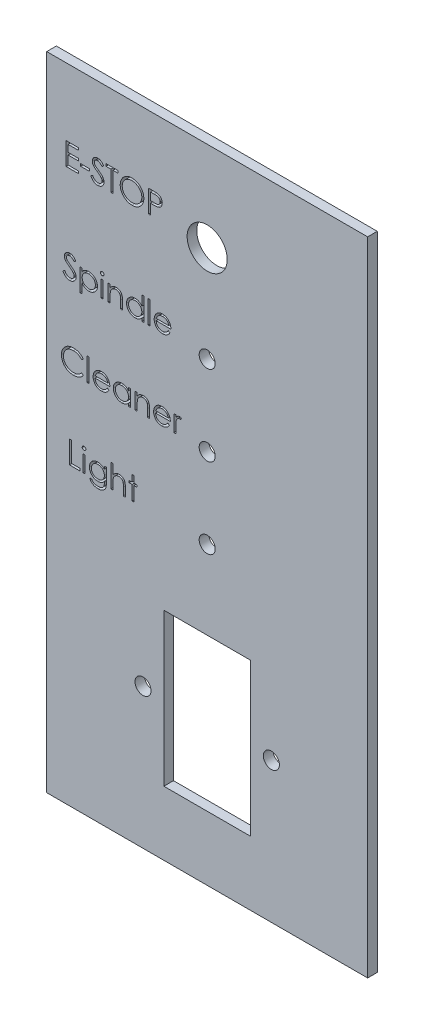
from build123d import *

# Parameters (mm, degrees)
SKETCH1_W           = 100
SKETCH1_H           = 200
BOSS_EXTRUDE1_DEPTH = 3
CUT_EXTRUDE1_REACH  = 113.844
SKETCH2_R           = 2.5
SKETCH2_W           = 27
SKETCH2_H           = 47.5
SKETCH3_R           = 6.25
SKETCH3_R_2         = 2.5
CUT_EXTRUDE2_DEPTH  = 112.843640856
SKETCH4_W           = 2.692307692
SKETCH4_H           = 0.717948718
SKETCH4_W_2         = 0.628205128
SKETCH4_H_2         = 7.179487179
SKETCH4_W_3         = 0.628205129
SKETCH4_H_3         = 5.115384615
CUT_EXTRUDE3_DEPTH  = 112.843640856


with BuildPart() as part:
    # Sketch1 → Boss-Extrude1 (new body)
    with BuildSketch(Plane.XY):
        Rectangle(SKETCH1_W, SKETCH1_H)
    extrude(amount=BOSS_EXTRUDE1_DEPTH)

    # Sketch2 → Cut-Extrude1 (cut, up to next)
    with BuildSketch(Plane.XY.offset(3), mode=Mode.PRIVATE) as cut_extrude1_sk1:
        with Locations((20, -56.25)):
            Circle(SKETCH2_R)
    cut_extrude1_tool1 = extrude(cut_extrude1_sk1.sketch, amount=-CUT_EXTRUDE1_REACH, mode=Mode.PRIVATE) & part.part
    # Sketch2 → Cut-Extrude1 (cut, up to next)
    with BuildSketch(Plane.XY.offset(3), mode=Mode.PRIVATE) as cut_extrude1_sk2:
        with Locations((-20, -56.25)):
            Circle(SKETCH2_R)
    cut_extrude1_tool2 = extrude(cut_extrude1_sk2.sketch, amount=-CUT_EXTRUDE1_REACH, mode=Mode.PRIVATE) & part.part
    # Sketch2 → Cut-Extrude1 (cut, up to next)
    with BuildSketch(Plane.XY.offset(3), mode=Mode.PRIVATE) as cut_extrude1_sk3:
        with Locations((0, -56.25)):
            Rectangle(SKETCH2_W, SKETCH2_H)
    cut_extrude1_tool3 = extrude(cut_extrude1_sk3.sketch, amount=-CUT_EXTRUDE1_REACH, mode=Mode.PRIVATE) & part.part
    add(cut_extrude1_tool1.solids().sort_by_distance((20, -56.25, 3))[0], mode=Mode.SUBTRACT)
    add(cut_extrude1_tool2.solids().sort_by_distance((-20, -56.25, 3))[0], mode=Mode.SUBTRACT)
    add(cut_extrude1_tool3.solids().sort_by_distance((0, -56.25, 3))[0], mode=Mode.SUBTRACT)

    # Sketch3 → Cut-Extrude2 (cut, through all)
    with BuildSketch(Plane.XY.offset(3)):
        with Locations((0, 72)):
            Circle(SKETCH3_R)
        with Locations((0, 42)):
            Circle(SKETCH3_R_2)
        with Locations((0, 17)):
            Circle(SKETCH3_R_2)
        with Locations((0, -8)):
            Circle(SKETCH3_R_2)
    extrude(amount=-CUT_EXTRUDE2_DEPTH, mode=Mode.SUBTRACT)

    # Sketch4 → Cut-Extrude3 (cut, through all)
    # profile 1 of 27: a face of its own
    with BuildSketch(Plane.XY.offset(3)):
        with BuildLine():
            Line((-18.307692308, 79), (-16.934895833, 79))
            add(Edge.make_bspline(
                [(-16.934895833, 79), (-16.840474021, 78.999896208), (-16.659557635, 78.999697337), (-16.400127524, 78.993667845), (-16.164508061, 78.985614461), (-15.953207299, 78.974450674), (-15.765575103, 78.961257494), (-15.602460504, 78.942753415), (-15.462581391, 78.923432824), (-15.378768492, 78.903790011), (-15.340544872, 78.894831731)],
                knots=[0, 0, 0, 0, 1.415646017, 2.712440637, 3.8905458, 4.950247383, 5.884950622, 6.709939814, 7.411656543, 8, 8, 8, 8], degree=3))
            add(Edge.make_bspline(
                [(-15.340544872, 78.894831731), (-15.292157804, 78.881587831), (-15.19652385, 78.855412108), (-15.058721764, 78.802984661), (-14.927614073, 78.74082033), (-14.802750956, 78.669972451), (-14.68566679, 78.587401322), (-14.574614708, 78.496454087), (-14.470574747, 78.39503095), (-14.374131963, 78.28426947), (-14.285562368, 78.16602905), (-14.209303003, 78.03854459), (-14.145448549, 77.903961984), (-14.090682006, 77.762374841), (-14.051265097, 77.612594194), (-14.021571297, 77.45566077), (-14.002724042, 77.291591389), (-14.000918919, 77.179471654), (-14, 77.122395833)],
                knots=[0, 0, 0, 0, 0.999701418, 1.975846123, 2.934577507, 3.890451536, 4.834027766, 5.787354733, 6.749476667, 7.726910423, 8.712836071, 9.690891519, 10.682875813, 11.679750201, 12.712814741, 13.765529915, 14.8625177, 16, 16, 16, 16], degree=3))
            add(Edge.make_bspline(
                [(-14, 77.122395833), (-14.000842849, 77.06484028), (-14.002491941, 76.952228952), (-14.022284512, 76.787483375), (-14.048944895, 76.630046595), (-14.089939, 76.480267694), (-14.143630346, 76.339036153), (-14.206614452, 76.204193689), (-14.282581513, 76.078034346), (-14.369871172, 75.96010011), (-14.466974361, 75.850280286), (-14.573480237, 75.749370697), (-14.688958822, 75.65796202), (-14.813043118, 75.575849333), (-14.946942816, 75.504936774), (-15.088627123, 75.441422164), (-15.239327556, 75.388080042), (-15.343612584, 75.36001992), (-15.396634615, 75.345753205)],
                knots=[0, 0, 0, 0, 1.121902311, 2.195077645, 3.232258892, 4.234102512, 5.217864754, 6.176164875, 7.132989551, 8.084763148, 9.034132444, 9.988522005, 10.94243251, 11.903244335, 12.886203696, 13.894208494, 14.929344452, 16, 16, 16, 16], degree=3))
            add(Edge.make_bspline(
                [(-15.396634615, 75.345753205), (-15.440489283, 75.336427243), (-15.536599338, 75.315988855), (-15.694884782, 75.293171941), (-15.879175554, 75.27369674), (-16.089220114, 75.259094464), (-16.324829924, 75.246593728), (-16.586132439, 75.23665754), (-16.873640593, 75.231197832), (-17.074183081, 75.230916246), (-17.178886218, 75.230769231)],
                knots=[0, 0, 0, 0, 0.601384939, 1.31797006, 2.144135048, 3.087295005, 4.142315834, 5.309527816, 6.595305764, 8, 8, 8, 8], degree=3))
            Line((-17.178886218, 75.230769231), (-17.679487179, 75.230769231))
            Line((-17.679487179, 75.230769231), (-17.679487179, 72))
            Line((-17.679487179, 72), (-18.307692308, 72))
            Line((-18.307692308, 72), (-18.307692308, 79))
        make_face()
        with BuildLine():
            Line((-17.679487179, 78.282051282), (-17.679487179, 75.948717949))
            Line((-17.679487179, 75.948717949), (-16.453926282, 75.933293269))
            add(Edge.make_bspline(
                [(-16.453926282, 75.933293269), (-16.39408643, 75.933262342), (-16.278566831, 75.933202638), (-16.111694384, 75.941173085), (-15.956875809, 75.95037415), (-15.814586659, 75.963845997), (-15.68476279, 75.982888512), (-15.567187732, 76.002111988), (-15.462773166, 76.029922713), (-15.340574763, 76.067368851), (-15.204408068, 76.131234083), (-15.056272971, 76.223933863), (-14.930731798, 76.342095279), (-14.822095204, 76.474950942), (-14.735883449, 76.622749201), (-14.672771464, 76.780887074), (-14.635689149, 76.947742773), (-14.630716762, 77.061919051), (-14.628205128, 77.119591346)],
                knots=[0, 0, 0, 0, 1.160613943, 2.240541288, 3.23993089, 4.169200891, 5.011653406, 5.7853311, 6.478053781, 7.106038997, 8.262395093, 9.384106736, 10.481365981, 11.59014053, 12.70357646, 13.786202915, 14.881775077, 16, 16, 16, 16], degree=3))
            add(Edge.make_bspline(
                [(-14.628205128, 77.119591346), (-14.630730421, 77.175868373), (-14.635750391, 77.287740137), (-14.673062117, 77.451697659), (-14.735760745, 77.608169067), (-14.822673934, 77.754115238), (-14.928156194, 77.886492846), (-15.05075488, 78.0014871), (-15.190181403, 78.093930506), (-15.319877865, 78.153597069), (-15.435080237, 78.19002762), (-15.535144157, 78.215517301), (-15.648125506, 78.235868513), (-15.774061065, 78.252347519), (-15.911974733, 78.266454441), (-16.063051362, 78.276026396), (-16.226718649, 78.281629308), (-16.340339791, 78.281907219), (-16.399238782, 78.282051282)],
                knots=[0, 0, 0, 0, 1.120700087, 2.227813068, 3.331159281, 4.466773991, 5.599788987, 6.693661531, 7.80175334, 8.91857717, 9.525282508, 10.207424825, 10.974604443, 11.810962634, 12.737642355, 13.736264703, 14.826523623, 16, 16, 16, 16], degree=3))
            Line((-16.399238782, 78.282051282), (-17.679487179, 78.282051282))
        make_face(mode=Mode.SUBTRACT)
    # profile 2 of 27: a face of its own
    with BuildSketch(Plane.XY.offset(3)):
        with BuildLine():
            add(Edge.make_bspline(
                [(-23.467948718, 79.179487179), (-23.338332506, 79.176204221), (-23.083755572, 79.169756219), (-22.709605777, 79.120398012), (-22.352415586, 79.035007232), (-22.009275309, 78.921281267), (-21.684289355, 78.769572496), (-21.37501157, 78.586202199), (-21.082177823, 78.369249282), (-20.80973506, 78.120390828), (-20.560421159, 77.84962392), (-20.340769387, 77.5606681), (-20.156684799, 77.255270496), (-20.005513225, 76.934348834), (-19.886916005, 76.598628898), (-19.805077918, 76.246320893), (-19.752801618, 75.879707513), (-19.746690063, 75.629653783), (-19.743589744, 75.502804487)],
                knots=[0, 0, 0, 0, 1.065120563, 2.091984664, 3.0946048, 4.079830382, 5.057816894, 6.036188127, 7.030412546, 8.04752943, 9.064399622, 10.05169764, 11.02544977, 11.989514704, 12.962713494, 13.945757189, 14.957906945, 16, 16, 16, 16], degree=3))
            add(Edge.make_bspline(
                [(-19.743589744, 75.502804487), (-19.746689609, 75.376889594), (-19.752799802, 75.128696754), (-19.805137357, 74.764409865), (-19.887219357, 74.414228472), (-20.004411889, 74.078737167), (-20.154862846, 73.757582039), (-20.340173188, 73.451608131), (-20.55845561, 73.160715135), (-20.806869312, 72.888089804), (-21.077671396, 72.638094863), (-21.36813193, 72.420257111), (-21.671718569, 72.232808862), (-21.992337986, 72.083241514), (-22.325738059, 71.963697673), (-22.674902706, 71.882192413), (-23.038195814, 71.829618327), (-23.285937821, 71.823581295), (-23.411858974, 71.820512821)],
                knots=[0, 0, 0, 0, 1.043624062, 2.057103931, 3.04512605, 4.022047818, 4.998200453, 5.980619268, 6.982898556, 8.009068085, 9.034988726, 10.034168286, 11.015286542, 11.987931943, 12.962482838, 13.94673481, 14.956375938, 16, 16, 16, 16], degree=3))
            add(Edge.make_bspline(
                [(-23.411858974, 71.820512821), (-23.538707612, 71.823611594), (-23.788760044, 71.829720102), (-24.155834115, 71.882082912), (-24.508389603, 71.963965519), (-24.845418305, 72.080984392), (-25.167108164, 72.232218853), (-25.47408833, 72.416627611), (-25.765126624, 72.635441894), (-26.037810117, 72.883775043), (-26.287308513, 73.154118147), (-26.504827265, 73.443786657), (-26.689277492, 73.74709757), (-26.840004156, 74.064892619), (-26.959333075, 74.395635504), (-27.040742711, 74.741532459), (-27.093414616, 75.100611471), (-27.099484309, 75.345097267), (-27.102564103, 75.469150641)],
                knots=[0, 0, 0, 0, 1.053102029, 2.075944431, 3.073151272, 4.055350789, 5.033113405, 6.020478099, 7.024410459, 8.052272461, 9.079885166, 10.07527673, 11.055994387, 12.023226415, 12.992069828, 13.970394897, 14.97016774, 16, 16, 16, 16], degree=3))
            add(Edge.make_bspline(
                [(-27.102564103, 75.469150641), (-27.101494832, 75.552415979), (-27.099369779, 75.717896226), (-27.073786394, 75.963629427), (-27.036662992, 76.205410742), (-26.983459166, 76.442552638), (-26.913875832, 76.674474607), (-26.831771778, 76.902776133), (-26.731492087, 77.125143581), (-26.618130791, 77.342630364), (-26.491607175, 77.551846176), (-26.351855676, 77.749605342), (-26.203784939, 77.937567336), (-26.041458152, 78.110861343), (-25.870225261, 78.274528656), (-25.687308505, 78.42605409), (-25.493824016, 78.566803992), (-25.288939257, 78.693644674), (-25.077702707, 78.808362943), (-24.859949151, 78.906806645), (-24.638636008, 78.991298768), (-24.412726713, 79.059780419), (-24.182821168, 79.113844491), (-23.948417599, 79.150659198), (-23.709702747, 79.176307834), (-23.548880109, 79.178422838), (-23.467948718, 79.179487179)],
                knots=[0, 0, 0, 0, 1.037015668, 2.060948919, 3.074880161, 4.083647147, 5.086022904, 6.090072063, 7.104153813, 8.122640571, 9.144368836, 10.147691507, 11.138137339, 12.123020368, 13.103399296, 14.087645067, 15.080126199, 16.082011238, 17.087798457, 18.072939717, 19.057185487, 20.037253025, 21.01195951, 21.997135196, 22.992090687, 24, 24, 24, 24], degree=3))
        make_face()
        with BuildLine():
            add(Edge.make_bspline(
                [(-23.437099359, 78.461538462), (-23.503528626, 78.460728681), (-23.635752092, 78.459116862), (-23.832321164, 78.43788543), (-24.026305032, 78.407625652), (-24.217743756, 78.364462611), (-24.405836335, 78.305654505), (-24.592336018, 78.237972689), (-24.775542125, 78.155530508), (-24.954849841, 78.062385099), (-25.128679991, 77.959287257), (-25.292705394, 77.845343723), (-25.447350682, 77.723226615), (-25.592237215, 77.59265094), (-25.72693956, 77.452951737), (-25.854108963, 77.306246864), (-25.968648126, 77.148343082), (-26.07361928, 76.983522269), (-26.16755496, 76.811999106), (-26.25108567, 76.635579382), (-26.319413687, 76.452824008), (-26.37513844, 76.265715693), (-26.421338061, 76.074550774), (-26.45060591, 75.877879076), (-26.472070629, 75.676688852), (-26.473590319, 75.540725144), (-26.474358974, 75.471955128)],
                knots=[0, 0, 0, 0, 1.008559885, 2.007477868, 2.99961109, 3.989939068, 4.984837346, 5.991145699, 7.001802488, 8.033829008, 9.059044045, 10.069351652, 11.065060232, 12.050310815, 13.029377138, 14.011219647, 14.996725999, 15.989392538, 16.977580475, 17.965360261, 18.951710183, 19.937753436, 20.929683414, 21.935841486, 22.955955122, 24, 24, 24, 24], degree=3))
            add(Edge.make_bspline(
                [(-26.474358974, 75.471955128), (-26.47180925, 75.370830687), (-26.466793155, 75.171887626), (-26.422878014, 74.880351338), (-26.355234066, 74.600174766), (-26.255519333, 74.332890947), (-26.130818103, 74.076202381), (-25.976764323, 73.832386172), (-25.794246152, 73.601376423), (-25.586919099, 73.384785885), (-25.360273685, 73.187094277), (-25.119608225, 73.01356746), (-24.86750101, 72.86674696), (-24.603294605, 72.747136815), (-24.328399527, 72.65235734), (-24.041044425, 72.587400077), (-23.743143506, 72.544649167), (-23.540082195, 72.540543655), (-23.437099359, 72.538461538)],
                knots=[0, 0, 0, 0, 1.032063989, 2.030389145, 3.003944642, 3.970395727, 4.937377036, 5.913328081, 6.909231446, 7.93887556, 8.970685674, 9.976071282, 10.964166581, 11.944589148, 12.933237628, 13.927779006, 14.949070134, 16, 16, 16, 16], degree=3))
            add(Edge.make_bspline(
                [(-23.437099359, 72.538461538), (-23.367880356, 72.539412547), (-23.230598283, 72.541298683), (-23.026407238, 72.560296037), (-22.825894815, 72.590759776), (-22.629342255, 72.634621087), (-22.436972632, 72.6895155), (-22.247983026, 72.754730956), (-22.064386445, 72.836093363), (-21.88386677, 72.925989266), (-21.711074286, 73.028469581), (-21.546123222, 73.138545881), (-21.393171262, 73.260483122), (-21.248393119, 73.389118747), (-21.113137741, 73.527046443), (-20.988319773, 73.674086886), (-20.874359509, 73.831168201), (-20.769428215, 73.995739012), (-20.67582169, 74.167731518), (-20.594263492, 74.344790874), (-20.52507126, 74.526481092), (-20.46921425, 74.713064235), (-20.425443327, 74.904185933), (-20.395283487, 75.100102089), (-20.37418661, 75.300420774), (-20.372596456, 75.435908486), (-20.371794872, 75.504206731)],
                knots=[0, 0, 0, 0, 1.047197238, 2.076906641, 3.100256066, 4.114471768, 5.12198147, 6.126382909, 7.136867548, 8.15857795, 9.17633901, 10.174870724, 11.156907918, 12.133735059, 13.104061851, 14.077631395, 15.04955518, 16.038496417, 17.029181396, 18.010275684, 18.986308667, 19.968651475, 20.955262928, 21.950658345, 22.966943676, 24, 24, 24, 24], degree=3))
            add(Edge.make_bspline(
                [(-20.371794872, 75.504206731), (-20.372597098, 75.572037739), (-20.374188461, 75.70659304), (-20.39527341, 75.905514676), (-20.425475191, 76.100021099), (-20.469000607, 76.289348705), (-20.525100914, 76.473545755), (-20.594275575, 76.652439251), (-20.675846174, 76.826695641), (-20.769462623, 76.995884235), (-20.87469427, 77.158233711), (-20.989682756, 77.313438536), (-21.116413453, 77.458584019), (-21.251265502, 77.597253407), (-21.397607273, 77.726489186), (-21.554775861, 77.846334227), (-21.720863217, 77.959680776), (-21.896717688, 78.0619319), (-22.078205595, 78.156360365), (-22.264433511, 78.237262371), (-22.45329171, 78.30600661), (-22.644299935, 78.36464054), (-22.839065892, 78.4074566), (-23.036273549, 78.4379127), (-23.235650066, 78.459109472), (-23.369736506, 78.460726229), (-23.437099359, 78.461538462)],
                knots=[0, 0, 0, 0, 1.02996197, 2.043119294, 3.035359645, 4.018872909, 4.991431989, 5.957985074, 6.929999688, 7.912076566, 8.892894881, 9.867085534, 10.843653904, 11.817741046, 12.803660682, 13.806313499, 14.818574707, 15.856120519, 16.894564902, 17.924820532, 18.937903209, 19.946497019, 20.957711757, 21.963978472, 22.977135795, 24, 24, 24, 24], degree=3))
        make_face(mode=Mode.SUBTRACT)
    # profile 3 of 27: a face of its own
    with BuildSketch(Plane.XY.offset(3)):
        Polygon((-31.5, 78.282051282), (-31.5, 79), (-27.820512821, 79), (-27.820512821, 78.282051282), (-29.346153846, 78.282051282), (-29.346153846, 72), (-29.974358974, 72), (-29.974358974, 78.282051282), align=None)
    # profile 4 of 27: a face of its own
    with BuildSketch(Plane.XY.offset(3)):
        with BuildLine():
            Line((-36.256410256, 73.350360577), (-35.664663462, 73.705128205))
            add(Edge.make_bspline(
                [(-35.664663462, 73.705128205), (-35.609626987, 73.612999435), (-35.504179226, 73.436484267), (-35.328276507, 73.197968187), (-35.146010685, 72.995243873), (-34.956032018, 72.829490658), (-34.759500122, 72.698992884), (-34.555132014, 72.606588421), (-34.343616393, 72.54895647), (-34.19966875, 72.541956297), (-34.127804487, 72.538461538)],
                knots=[0, 0, 0, 0, 1.272034388, 2.437168799, 3.508375237, 4.49857839, 5.41946034, 6.295179144, 7.148887113, 8, 8, 8, 8], degree=3))
            add(Edge.make_bspline(
                [(-34.127804487, 72.538461538), (-34.066430766, 72.540170883), (-33.94475722, 72.543559664), (-33.765632734, 72.576121268), (-33.59166913, 72.626145526), (-33.426451854, 72.697787389), (-33.272260625, 72.78446436), (-33.137047234, 72.889156715), (-33.020155008, 73.006369127), (-32.924536779, 73.137134436), (-32.851176708, 73.277768733), (-32.794792572, 73.422120636), (-32.763502424, 73.572457773), (-32.758788917, 73.673678698), (-32.756410256, 73.724759615)],
                knots=[0, 0, 0, 0, 1.095163259, 2.171163733, 3.241058638, 4.321873601, 5.38011039, 6.391990106, 7.366004449, 8.327778327, 9.272591725, 10.192022065, 11.087607919, 12, 12, 12, 12], degree=3))
            add(Edge.make_bspline(
                [(-32.756410256, 73.724759615), (-32.759358878, 73.783041315), (-32.765352994, 73.901519493), (-32.816015954, 74.076318799), (-32.895714448, 74.249303939), (-32.969239735, 74.35630647), (-33.007411859, 74.411858974)],
                knots=[0, 0, 0, 0, 0.938893495, 1.908633276, 2.914225137, 4, 4, 4, 4], degree=3))
            add(Edge.make_bspline(
                [(-33.007411859, 74.411858974), (-33.038753087, 74.451952622), (-33.104550076, 74.536124219), (-33.217665101, 74.66141469), (-33.35039733, 74.790651528), (-33.49820444, 74.928769641), (-33.666470617, 75.069345235), (-33.849925646, 75.219081791), (-34.053253364, 75.372284945), (-34.195852357, 75.475030076), (-34.26943109, 75.528044872)],
                knots=[0, 0, 0, 0, 0.722233717, 1.516239348, 2.393582979, 3.351407094, 4.387010283, 5.505090956, 6.712668013, 8, 8, 8, 8], degree=3))
            add(Edge.make_bspline(
                [(-34.26943109, 75.528044872), (-34.343079082, 75.580502047), (-34.483888435, 75.680796172), (-34.6808056, 75.82964474), (-34.856894526, 75.965732479), (-35.011372559, 76.090340503), (-35.144171753, 76.203485712), (-35.256338575, 76.304081591), (-35.345015689, 76.394848712), (-35.39432685, 76.453731396), (-35.416466346, 76.480168269)],
                knots=[0, 0, 0, 0, 1.452282411, 2.77665338, 3.964542531, 5.026858415, 5.96415736, 6.766646006, 7.446254459, 8, 8, 8, 8], degree=3))
            add(Edge.make_bspline(
                [(-35.416466346, 76.480168269), (-35.447411437, 76.521370343), (-35.50826911, 76.60239975), (-35.588601121, 76.729049466), (-35.656879447, 76.858695997), (-35.710404111, 76.991687726), (-35.755476549, 77.126157584), (-35.78579241, 77.263860075), (-35.804775204, 77.404177312), (-35.806719177, 77.498604313), (-35.807692308, 77.545873397)],
                knots=[0, 0, 0, 0, 1.068054152, 2.10047183, 3.106115577, 4.101338837, 5.06977816, 6.043150881, 7.020423561, 8, 8, 8, 8], degree=3))
            add(Edge.make_bspline(
                [(-35.807692308, 77.545873397), (-35.80508189, 77.619932947), (-35.79991685, 77.766469074), (-35.756235815, 77.980530735), (-35.687290028, 78.184903569), (-35.590700252, 78.377564237), (-35.466185546, 78.553496199), (-35.322093597, 78.714723173), (-35.150470625, 78.850260337), (-34.962165378, 78.968684454), (-34.756052634, 79.061376304), (-34.540070827, 79.131298264), (-34.313876683, 79.17091678), (-34.160670414, 79.17660231), (-34.082932692, 79.179487179)],
                knots=[0, 0, 0, 0, 1.005424448, 1.989358655, 2.955360095, 3.929531133, 4.905563448, 5.876582895, 6.856512386, 7.866279853, 8.892233794, 9.918561126, 10.94386622, 12, 12, 12, 12], degree=3))
            add(Edge.make_bspline(
                [(-34.082932692, 79.179487179), (-34.000444492, 79.176642076), (-33.836401788, 79.170984074), (-33.595103357, 79.121789011), (-33.362781924, 79.040387668), (-33.175895395, 78.948010352), (-33.029629872, 78.85574752), (-32.918084406, 78.771707872), (-32.805049505, 78.674957655), (-32.689613395, 78.565239163), (-32.573732076, 78.44154566), (-32.455685172, 78.304724283), (-32.335196634, 78.155611171), (-32.257684914, 78.049162169), (-32.217948718, 77.994591346)],
                knots=[0, 0, 0, 0, 1.286793592, 2.559021753, 3.825965368, 5.121522368, 5.803751409, 6.523245864, 7.299691795, 8.125521123, 9.008227632, 9.944561021, 10.946284179, 12, 12, 12, 12], degree=3))
            Line((-32.217948718, 77.994591346), (-32.785857372, 77.564102564))
            add(Edge.make_bspline(
                [(-32.785857372, 77.564102564), (-32.820149237, 77.608279945), (-32.886187351, 77.693355251), (-32.986446325, 77.812497883), (-33.08094362, 77.921330842), (-33.17404442, 78.015861098), (-33.260831683, 78.101265364), (-33.345065767, 78.174384878), (-33.42553447, 78.235936069), (-33.526968291, 78.301623189), (-33.654403728, 78.366736196), (-33.8143728, 78.421834352), (-33.98154535, 78.454944476), (-34.095404613, 78.459322251), (-34.153044872, 78.461538462)],
                knots=[0, 0, 0, 0, 1.181633172, 2.275549214, 3.290209073, 4.226197932, 5.078386478, 5.862611352, 6.581680152, 7.217281963, 8.414376989, 9.595101626, 10.782541182, 12, 12, 12, 12], degree=3))
            add(Edge.make_bspline(
                [(-34.153044872, 78.461538462), (-34.225357917, 78.459115062), (-34.364806811, 78.454441763), (-34.562787284, 78.403401793), (-34.740975134, 78.323038072), (-34.894080264, 78.210408116), (-35.021554218, 78.07696613), (-35.113765136, 77.92340842), (-35.169265465, 77.753843615), (-35.176038024, 77.635560302), (-35.179487179, 77.575320513)],
                knots=[0, 0, 0, 0, 1.14458467, 2.207223713, 3.21896685, 4.227309161, 5.202851033, 6.127160689, 7.046193047, 8, 8, 8, 8], degree=3))
            add(Edge.make_bspline(
                [(-35.179487179, 77.575320513), (-35.178700926, 77.537817556), (-35.177127134, 77.462750317), (-35.155177539, 77.351847473), (-35.126978881, 77.241224794), (-35.082293617, 77.131379628), (-35.02060301, 77.02039091), (-34.939592658, 76.906347435), (-34.837566034, 76.788244018), (-34.759412009, 76.71142927), (-34.718149038, 76.670873397)],
                knots=[0, 0, 0, 0, 0.858281714, 1.717966888, 2.583508476, 3.4729293, 4.427298488, 5.488583878, 6.674047936, 8, 8, 8, 8], degree=3))
            add(Edge.make_bspline(
                [(-34.718149038, 76.670873397), (-34.702826294, 76.657199346), (-34.666422959, 76.624712929), (-34.599871108, 76.571528368), (-34.511985511, 76.505922823), (-34.405061109, 76.42474819), (-34.277126386, 76.330585266), (-34.128167273, 76.224638042), (-33.959844208, 76.103467124), (-33.840400376, 76.018752043), (-33.77724359, 75.973958333)],
                knots=[0, 0, 0, 0, 0.420754252, 0.999615792, 1.744751191, 2.668019286, 3.750313428, 4.999500688, 6.413464383, 8, 8, 8, 8], degree=3))
            add(Edge.make_bspline(
                [(-33.77724359, 75.973958333), (-33.701271763, 75.918675614), (-33.55416285, 75.811628291), (-33.344847691, 75.650796931), (-33.155060074, 75.493501394), (-32.984133667, 75.340746179), (-32.83037985, 75.193689993), (-32.695504409, 75.050563633), (-32.578133048, 74.912392487), (-32.451774611, 74.735247336), (-32.322658972, 74.517685167), (-32.211775957, 74.25112869), (-32.141859263, 73.983536049), (-32.132716232, 73.803682376), (-32.128205128, 73.71494391)],
                knots=[0, 0, 0, 0, 1.163667725, 2.253281268, 3.268753668, 4.215851969, 5.092017293, 5.902905408, 6.650798638, 7.335211899, 8.59617414, 9.77448103, 10.901945474, 12, 12, 12, 12], degree=3))
            add(Edge.make_bspline(
                [(-32.128205128, 73.71494391), (-32.129519404, 73.65218718), (-32.132122435, 73.527892413), (-32.162044262, 73.345382259), (-32.205883592, 73.16812052), (-32.27195806, 72.998298295), (-32.352604377, 72.83280877), (-32.454936873, 72.675992969), (-32.573552242, 72.524380172), (-32.709619772, 72.382013189), (-32.858511577, 72.251320797), (-33.015878966, 72.135062674), (-33.181979512, 72.038126027), (-33.355912145, 71.959024343), (-33.537716819, 71.897157308), (-33.727332386, 71.85233157), (-33.925071409, 71.824820148), (-34.059472372, 71.821964625), (-34.127804487, 71.820512821)],
                knots=[0, 0, 0, 0, 0.983748083, 1.948392443, 2.894712957, 3.844097841, 4.80183111, 5.778335162, 6.776009319, 7.81870978, 8.863265674, 9.881300176, 10.883814829, 11.87499822, 12.874611388, 13.892143829, 14.928324115, 16, 16, 16, 16], degree=3))
            add(Edge.make_bspline(
                [(-34.127804487, 71.820512821), (-34.180675173, 71.821535184), (-34.285750693, 71.823567034), (-34.441169657, 71.841529595), (-34.593448835, 71.866943803), (-34.740677399, 71.907291942), (-34.884752223, 71.956245897), (-35.025046692, 72.016522562), (-35.1616288, 72.088756965), (-35.295263965, 72.171347014), (-35.425612314, 72.267462503), (-35.55145125, 72.379409496), (-35.676909621, 72.504100506), (-35.798284414, 72.644921633), (-35.918030703, 72.799597798), (-36.033787522, 72.969576165), (-36.147950957, 73.153930873), (-36.219581893, 73.283661044), (-36.256410256, 73.350360577)],
                knots=[0, 0, 0, 0, 0.915332311, 1.819136955, 2.706846663, 3.586547465, 4.459518054, 5.340707479, 6.227863349, 7.133153174, 8.059268498, 9.028702269, 10.047606654, 11.120612155, 12.245963614, 13.433783089, 14.680604001, 16, 16, 16, 16], degree=3))
        make_face()
    # profile 5 of 27: a face of its own
    with BuildSketch(Plane.XY.offset(3)):
        with Locations((-38.051282051, 74.692307692)):
            Rectangle(SKETCH4_W, SKETCH4_H)
    # profile 6 of 27: a face of its own
    with BuildSketch(Plane.XY.offset(3)):
        Polygon((-43.974358974, 79), (-40.025641026, 79), (-40.025641026, 78.282051282), (-43.346153846, 78.282051282), (-43.346153846, 76.128205128), (-40.025641026, 76.128205128), (-40.025641026, 75.41025641), (-43.346153846, 75.41025641), (-43.346153846, 72.717948718), (-40.025641026, 72.717948718), (-40.025641026, 72), (-43.974358974, 72), align=None)
    # profile 7 of 27: a face of its own
    with BuildSketch(Plane.XY.offset(3)):
        with BuildLine():
            Line((-12.135016026, 43.615384615), (-11.576923077, 43.322315705))
            add(Edge.make_bspline(
                [(-11.576923077, 43.322315705), (-11.621396267, 43.243429043), (-11.707923484, 43.089946837), (-11.85672498, 42.879083116), (-12.012709125, 42.689387684), (-12.182917061, 42.525928376), (-12.362256419, 42.383425606), (-12.551721729, 42.258749956), (-12.752299364, 42.152512916), (-12.963998814, 42.06300786), (-13.188597916, 41.994188872), (-13.426640949, 41.94558043), (-13.67858394, 41.915533893), (-13.851276299, 41.912043611), (-13.939703526, 41.91025641)],
                knots=[0, 0, 0, 0, 1.120438281, 2.179929193, 3.190490725, 4.156257408, 5.095198341, 6.022838206, 6.959905092, 7.901321166, 8.864066838, 9.862729781, 10.905609505, 12, 12, 12, 12], degree=3))
            add(Edge.make_bspline(
                [(-13.939703526, 41.91025641), (-14.037987481, 41.912550761), (-14.229711004, 41.917026374), (-14.508790498, 41.955611303), (-14.771549335, 42.018556021), (-15.017972742, 42.106487104), (-15.247457247, 42.221341752), (-15.460458957, 42.361260715), (-15.658098008, 42.525525225), (-15.834146427, 42.715558112), (-15.992634192, 42.918922026), (-16.132485832, 43.130833795), (-16.249400694, 43.350760244), (-16.344505915, 43.577301292), (-16.421315644, 43.809029079), (-16.474849052, 44.048052015), (-16.505708548, 44.293723183), (-16.510437439, 44.459917854), (-16.512820513, 44.543669872)],
                knots=[0, 0, 0, 0, 1.145258523, 2.234067595, 3.276747158, 4.290159414, 5.277019952, 6.260822364, 7.254936242, 8.264827045, 9.274100331, 10.257902744, 11.220704747, 12.172965371, 13.118907548, 14.062713208, 15.023725156, 16, 16, 16, 16], degree=3))
            add(Edge.make_bspline(
                [(-16.512820513, 44.543669872), (-16.51070223, 44.622259533), (-16.506504074, 44.778013862), (-16.480042499, 45.008544951), (-16.433145913, 45.232601856), (-16.368793265, 45.450370752), (-16.285690772, 45.66148702), (-16.184026334, 45.866079147), (-16.063641578, 46.063929427), (-15.970696231, 46.188735694), (-15.923878205, 46.251602564)],
                knots=[0, 0, 0, 0, 1.024358464, 2.0301432, 3.019427413, 4.004406732, 4.986367066, 5.972626655, 6.978780325, 8, 8, 8, 8], degree=3))
            add(Edge.make_bspline(
                [(-15.923878205, 46.251602564), (-15.86046284, 46.327340304), (-15.735640946, 46.476416605), (-15.524528236, 46.672293257), (-15.295927843, 46.836380807), (-15.052704591, 46.972395079), (-14.792031643, 47.075742373), (-14.517413061, 47.152757538), (-14.225721888, 47.19591356), (-14.026311446, 47.202009227), (-13.924278846, 47.205128205)],
                knots=[0, 0, 0, 0, 1.030682036, 2.02871468, 2.997146059, 3.962720338, 4.930598197, 5.918074684, 6.934738563, 8, 8, 8, 8], degree=3))
            add(Edge.make_bspline(
                [(-13.924278846, 47.205128205), (-13.819383636, 47.202420107), (-13.613603144, 47.197107437), (-13.313538902, 47.14785477), (-13.029617469, 47.069749661), (-12.76195246, 46.95944208), (-12.510516738, 46.817122976), (-12.276944639, 46.640839293), (-12.057241614, 46.436003119), (-11.929424456, 46.2784767), (-11.864383013, 46.198317308)],
                knots=[0, 0, 0, 0, 1.056321875, 2.072262726, 3.055038591, 4.01806755, 4.982017516, 5.957941055, 6.960871419, 8, 8, 8, 8], degree=3))
            add(Edge.make_bspline(
                [(-11.864383013, 46.198317308), (-11.820129136, 46.137910145), (-11.73191595, 46.017497908), (-11.62142175, 45.821155593), (-11.52550696, 45.615734405), (-11.448841038, 45.39791381), (-11.386762036, 45.17027465), (-11.341848398, 44.931189561), (-11.315509161, 44.680729738), (-11.310331766, 44.510076627), (-11.307692308, 44.423076923)],
                knots=[0, 0, 0, 0, 0.94817472, 1.890038105, 2.849395472, 3.817997239, 4.812318967, 5.836947057, 6.897266129, 8, 8, 8, 8], degree=3))
            Line((-11.307692308, 44.423076923), (-15.884615385, 44.423076923))
            add(Edge.make_bspline(
                [(-15.884615385, 44.423076923), (-15.881536172, 44.355675995), (-15.875481024, 44.223134787), (-15.847250738, 44.029193221), (-15.80275319, 43.844446537), (-15.740215065, 43.670280453), (-15.664481374, 43.504420198), (-15.571709941, 43.348096124), (-15.461030833, 43.202020264), (-15.337579434, 43.064885988), (-15.200165243, 42.942764466), (-15.055599749, 42.833460914), (-14.901812619, 42.74184972), (-14.740016452, 42.667489941), (-14.570472882, 42.609277309), (-14.393128491, 42.569541667), (-14.208332259, 42.542927453), (-14.082360791, 42.539968123), (-14.018229167, 42.538461538)],
                knots=[0, 0, 0, 0, 1.094153842, 2.151609401, 3.174256925, 4.172055639, 5.149267565, 6.128595816, 7.11444997, 8.118368179, 9.117203808, 10.09244225, 11.054858984, 12.015122123, 12.976791628, 13.957293641, 14.960065497, 16, 16, 16, 16], degree=3))
            add(Edge.make_bspline(
                [(-14.018229167, 42.538461538), (-13.955526871, 42.539677652), (-13.83111349, 42.542090654), (-13.645831775, 42.565554476), (-13.46355272, 42.603495027), (-13.285030754, 42.655275007), (-13.113889062, 42.718428711), (-12.955397962, 42.794634427), (-12.80963753, 42.87893392), (-12.673403597, 42.97535327), (-12.54126161, 43.093369644), (-12.410176638, 43.240641086), (-12.269623331, 43.414816142), (-12.181644145, 43.545907474), (-12.135016026, 43.615384615)],
                knots=[0, 0, 0, 0, 0.99110716, 1.966546729, 2.947904876, 3.932708344, 4.903319531, 5.828989031, 6.710028674, 7.56322171, 8.463672341, 9.504779593, 10.677557249, 12, 12, 12, 12], degree=3))
        make_face()
        with BuildLine():
            add(Edge.make_bspline(
                [(-11.935897436, 45.051282051), (-11.958890685, 45.134607799), (-12.003145288, 45.29498304), (-12.095618017, 45.517064821), (-12.199761098, 45.714440623), (-12.323004561, 45.885599889), (-12.462642012, 46.037606915), (-12.623932378, 46.170444085), (-12.804804165, 46.289278987), (-13.004322446, 46.389583986), (-13.215606016, 46.474963704), (-13.4368184, 46.532213935), (-13.662533976, 46.57143302), (-13.815202548, 46.575085237), (-13.892027244, 46.576923077)],
                knots=[0, 0, 0, 0, 1.154881502, 2.222775134, 3.210006277, 4.132804581, 5.035138423, 5.962687519, 6.919655026, 7.923214229, 8.944639381, 9.960483929, 10.97369054, 12, 12, 12, 12], degree=3))
            add(Edge.make_bspline(
                [(-13.892027244, 46.576923077), (-13.954726121, 46.575699734), (-14.078668619, 46.573281442), (-14.261270755, 46.550341183), (-14.436630153, 46.512421493), (-14.606040728, 46.46049158), (-14.767282465, 46.391274375), (-14.923672001, 46.310107922), (-15.071232794, 46.211024754), (-15.163515385, 46.135507045), (-15.210136218, 46.097355769)],
                knots=[0, 0, 0, 0, 1.04873581, 2.073130211, 3.073294108, 4.04793562, 5.032784715, 6.005352987, 6.992311501, 8, 8, 8, 8], degree=3))
            add(Edge.make_bspline(
                [(-15.210136218, 46.097355769), (-15.243522782, 46.067167138), (-15.31108905, 46.006072706), (-15.401370093, 45.900814293), (-15.487811039, 45.787311168), (-15.566478344, 45.661220919), (-15.638633517, 45.523979361), (-15.706153471, 45.376744091), (-15.766926296, 45.21839783), (-15.801118516, 45.108052952), (-15.818709936, 45.051282051)],
                knots=[0, 0, 0, 0, 0.879870761, 1.780643979, 2.707998968, 3.669668524, 4.684282772, 5.740141944, 6.837334558, 8, 8, 8, 8], degree=3))
            Line((-15.818709936, 45.051282051), (-11.935897436, 45.051282051))
        make_face(mode=Mode.SUBTRACT)
    # profile 8 of 27: a face of its own
    with BuildSketch(Plane.XY.offset(3)):
        with Locations((-18.083333333, 45.58974359)):
            Rectangle(SKETCH4_W_2, SKETCH4_H_2)
    # profile 9 of 27: a face of its own
    with BuildSketch(Plane.XY.offset(3)):
        with BuildLine():
            Line((-19.743589744, 49.179487179), (-19.743589744, 42))
            Line((-19.743589744, 42), (-20.371794872, 42))
            Line((-20.371794872, 42), (-20.371794872, 42.884815705))
            add(Edge.make_bspline(
                [(-20.371794872, 42.884815705), (-20.442632453, 42.804736517), (-20.580872884, 42.648460975), (-20.81175512, 42.44429663), (-21.056491475, 42.275539987), (-21.313894118, 42.139240156), (-21.583730604, 42.036856043), (-21.865402779, 41.964083725), (-22.159025541, 41.917296054), (-22.35953025, 41.912624011), (-22.461137821, 41.91025641)],
                knots=[0, 0, 0, 0, 1.074387032, 2.096679803, 3.090159297, 4.057316773, 5.018401886, 5.985159533, 6.978961417, 8, 8, 8, 8], degree=3))
            add(Edge.make_bspline(
                [(-22.461137821, 41.91025641), (-22.551473728, 41.912709155), (-22.729620138, 41.917546076), (-22.991678292, 41.955070683), (-23.243862791, 42.015331926), (-23.486411936, 42.099133705), (-23.717756227, 42.210295348), (-23.939876421, 42.343377844), (-24.151621805, 42.501859505), (-24.349764883, 42.683035561), (-24.532228883, 42.879825536), (-24.692351429, 43.089716629), (-24.825857588, 43.311801237), (-24.93749775, 43.543267545), (-25.023490439, 43.785897384), (-25.083437707, 44.03885172), (-25.120918601, 44.301831467), (-25.125753522, 44.480910513), (-25.128205128, 44.571714744)],
                knots=[0, 0, 0, 0, 1.033919861, 2.038935746, 3.024066025, 3.998881131, 4.97069526, 5.957263378, 6.95902576, 7.993208707, 9.027059324, 10.027763471, 11.009749337, 11.988697705, 12.965288445, 13.950418724, 14.960734635, 16, 16, 16, 16], degree=3))
            add(Edge.make_bspline(
                [(-25.128205128, 44.571714744), (-25.125699185, 44.660642151), (-25.120745072, 44.836446837), (-25.083838632, 45.095004233), (-25.021776615, 45.344040755), (-24.934680919, 45.582754641), (-24.82299701, 45.811434742), (-24.687140835, 46.030242792), (-24.527102586, 46.239781587), (-24.342597772, 46.43512404), (-24.142728232, 46.615565269), (-23.92891077, 46.77238336), (-23.706464207, 46.907817057), (-23.471938186, 47.01512401), (-23.228803977, 47.101942219), (-22.974897085, 47.162008155), (-22.711273928, 47.197402798), (-22.532292944, 47.202528326), (-22.44150641, 47.205128205)],
                knots=[0, 0, 0, 0, 1.020392517, 2.01726096, 2.990465484, 3.961182959, 4.928053699, 5.906110375, 6.912531644, 7.948652711, 8.985773172, 9.998621852, 10.987621588, 11.969261332, 12.953316658, 13.946091881, 14.958173133, 16, 16, 16, 16], degree=3))
            add(Edge.make_bspline(
                [(-22.44150641, 47.205128205), (-22.337072795, 47.201994013), (-22.132081213, 47.195841942), (-21.83228417, 47.144429208), (-21.548708949, 47.058103453), (-21.279722974, 46.93992089), (-21.026929854, 46.786319388), (-20.788476573, 46.600816492), (-20.568509927, 46.3781622), (-20.438366282, 46.210939053), (-20.371794872, 46.125400641)],
                knots=[0, 0, 0, 0, 1.031072012, 2.023879775, 2.993683497, 3.952812103, 4.918022106, 5.908088563, 6.929940113, 8, 8, 8, 8], degree=3))
            Line((-20.371794872, 46.125400641), (-20.371794872, 49.179487179))
            Line((-20.371794872, 49.179487179), (-19.743589744, 49.179487179))
        make_face()
        with BuildLine():
            add(Edge.make_bspline(
                [(-22.433092949, 46.576923077), (-22.524921624, 46.573655801), (-22.706176824, 46.567206719), (-22.972264829, 46.516859729), (-23.226891657, 46.43309054), (-23.468783805, 46.318526738), (-23.694120238, 46.174469265), (-23.89550758, 46.000226498), (-24.074592983, 45.80055247), (-24.225209511, 45.576348249), (-24.347990505, 45.335992067), (-24.434324569, 45.084743191), (-24.491263064, 44.827133236), (-24.497080105, 44.652407864), (-24.5, 44.564703526)],
                knots=[0, 0, 0, 0, 1.031046209, 2.035121221, 3.029706178, 4.034933723, 5.034054252, 6.02443088, 7.017295772, 8.038157696, 9.050218397, 10.03989886, 11.016116709, 12, 12, 12, 12], degree=3))
            add(Edge.make_bspline(
                [(-24.5, 44.564703526), (-24.496270213, 44.477523311), (-24.48882526, 44.3035046), (-24.435323871, 44.045543446), (-24.345564124, 43.794235362), (-24.223079999, 43.551713375), (-24.069706749, 43.326545174), (-23.891929444, 43.123064929), (-23.688028881, 42.948085752), (-23.462173867, 42.801610605), (-23.220957926, 42.683285563), (-22.967290063, 42.600954284), (-22.705938787, 42.547798723), (-22.528234119, 42.54158977), (-22.438701923, 42.538461538)],
                knots=[0, 0, 0, 0, 0.979072187, 1.954306742, 2.945804271, 3.96968567, 4.997920485, 5.998718438, 6.996577872, 8.005894225, 9.015743152, 10.005417472, 10.995077863, 12, 12, 12, 12], degree=3))
            add(Edge.make_bspline(
                [(-22.438701923, 42.538461538), (-22.347808918, 42.541781466), (-22.167031745, 42.548384474), (-21.900154329, 42.598947004), (-21.641164403, 42.682484601), (-21.393589946, 42.798282854), (-21.162957684, 42.941797566), (-20.955961929, 43.109811748), (-20.780929992, 43.305218116), (-20.632544773, 43.519971022), (-20.51619394, 43.755395015), (-20.431441821, 44.006063397), (-20.38133401, 44.271984893), (-20.37501855, 44.453712747), (-20.371794872, 44.546474359)],
                knots=[0, 0, 0, 0, 1.01762866, 2.023962475, 3.030623092, 4.058876274, 5.077231937, 6.066672613, 7.034107872, 8.005628644, 8.981990164, 9.965428785, 10.961468474, 12, 12, 12, 12], degree=3))
            add(Edge.make_bspline(
                [(-20.371794872, 44.546474359), (-20.373714185, 44.61715002), (-20.377491999, 44.756262087), (-20.406353138, 44.960517122), (-20.452262991, 45.155984574), (-20.516955331, 45.342869952), (-20.6019379, 45.520139983), (-20.704433432, 45.689067503), (-20.826244331, 45.848773926), (-20.965409724, 45.997060068), (-21.117740129, 46.132312992), (-21.27892921, 46.253041474), (-21.450886704, 46.352219019), (-21.630720778, 46.434301562), (-21.818743447, 46.499619862), (-22.016484686, 46.54319525), (-22.22184266, 46.573115892), (-22.361934771, 46.575640653), (-22.433092949, 46.576923077)],
                knots=[0, 0, 0, 0, 1.050140795, 2.067009409, 3.05949893, 4.030605086, 5.00011959, 5.97591094, 6.962425594, 7.979863591, 8.993523472, 9.986985069, 10.967611495, 11.937549037, 12.921786183, 13.919465291, 14.943216303, 16, 16, 16, 16], degree=3))
        make_face(mode=Mode.SUBTRACT)
    # profile 10 of 27: a face of its own
    with BuildSketch(Plane.XY.offset(3)):
        with BuildLine():
            Line((-30.871794872, 47.115384615), (-30.243589744, 47.115384615))
            Line((-30.243589744, 47.115384615), (-30.243589744, 46.192708333))
            add(Edge.make_bspline(
                [(-30.243589744, 46.192708333), (-30.176514473, 46.276393779), (-30.046352571, 46.438788306), (-29.829583905, 46.652229455), (-29.600496104, 46.828119905), (-29.360492097, 46.968327493), (-29.109246077, 47.074020745), (-28.848289537, 47.150352608), (-28.576060125, 47.196122265), (-28.390931251, 47.202102725), (-28.297275641, 47.205128205)],
                knots=[0, 0, 0, 0, 1.12780773, 2.188550248, 3.19190651, 4.159438251, 5.104880172, 6.052711206, 7.014878035, 8, 8, 8, 8], degree=3))
            add(Edge.make_bspline(
                [(-28.297275641, 47.205128205), (-28.202614373, 47.201637814), (-28.017339437, 47.194806277), (-27.747583315, 47.140772895), (-27.495636527, 47.048482385), (-27.262397416, 46.922058244), (-27.052142989, 46.764845297), (-26.867493286, 46.581689734), (-26.714766791, 46.371017567), (-26.612372065, 46.175571255), (-26.54492077, 46.002193666), (-26.502456095, 45.853700166), (-26.466394132, 45.688263864), (-26.435130636, 45.506384686), (-26.413976412, 45.306788305), (-26.397291829, 45.090292921), (-26.38533444, 44.85696866), (-26.384860026, 44.695595405), (-26.384615385, 44.612379808)],
                knots=[0, 0, 0, 0, 1.235846778, 2.418850247, 3.575807741, 4.728682307, 5.871620074, 6.994088408, 8.11269785, 9.256955736, 9.865816715, 10.540099792, 11.271859618, 12.076849838, 12.949306005, 13.892391288, 14.913166135, 16, 16, 16, 16], degree=3))
            Line((-26.384615385, 44.612379808), (-26.384615385, 42))
            Line((-26.384615385, 42), (-27.012820513, 42))
            Line((-27.012820513, 42), (-27.012820513, 44.40625))
            add(Edge.make_bspline(
                [(-27.012820513, 44.40625), (-27.013206929, 44.47589489), (-27.013946077, 44.609113711), (-27.01627737, 44.799851758), (-27.021896984, 44.972824915), (-27.029793609, 45.127619649), (-27.04135167, 45.264087323), (-27.053396933, 45.382505876), (-27.068126887, 45.482724961), (-27.081252713, 45.543055126), (-27.087139423, 45.570112179)],
                knots=[0, 0, 0, 0, 1.430800155, 2.736877192, 3.918605307, 4.986035426, 5.920637409, 6.731861385, 7.431261377, 8, 8, 8, 8], degree=3))
            add(Edge.make_bspline(
                [(-27.087139423, 45.570112179), (-27.108390486, 45.649534549), (-27.149292207, 45.802398039), (-27.250360174, 46.009746744), (-27.377988535, 46.18614312), (-27.533784234, 46.330496563), (-27.716242385, 46.442838236), (-27.924856671, 46.520786146), (-28.157613952, 46.569538684), (-28.321322718, 46.574392948), (-28.406650641, 46.576923077)],
                knots=[0, 0, 0, 0, 1.084156227, 2.086665306, 3.027808233, 3.945421172, 4.874247719, 5.839848303, 6.874090471, 8, 8, 8, 8], degree=3))
            add(Edge.make_bspline(
                [(-28.406650641, 46.576923077), (-28.457186008, 46.575971068), (-28.557194194, 46.574087066), (-28.705494138, 46.55518447), (-28.849342484, 46.524267558), (-28.990182902, 46.482530283), (-29.12519849, 46.425205745), (-29.258727072, 46.360147005), (-29.3857406, 46.279050581), (-29.508947395, 46.188669338), (-29.62357301, 46.088510923), (-29.730229687, 45.982821903), (-29.825305727, 45.870270695), (-29.911443078, 45.7526708), (-29.985799605, 45.628407124), (-30.050705781, 45.498678511), (-30.10577717, 45.363314214), (-30.133142555, 45.269364091), (-30.146834936, 45.222355769)],
                knots=[0, 0, 0, 0, 1.023777757, 2.026029729, 3.023749952, 4.003683103, 4.997618607, 5.993177895, 7.010360494, 8.046726602, 9.087585522, 10.09234134, 11.086953743, 12.070360549, 13.043493632, 14.017870808, 15.008233677, 16, 16, 16, 16], degree=3))
            add(Edge.make_bspline(
                [(-30.146834936, 45.222355769), (-30.154714233, 45.187845363), (-30.171867051, 45.112718014), (-30.19039341, 44.989429176), (-30.207208561, 44.846809226), (-30.221282479, 44.685024591), (-30.229893311, 44.503508841), (-30.239282105, 44.303037166), (-30.242700227, 44.082810189), (-30.243284935, 43.929486803), (-30.243589744, 43.849559295)],
                knots=[0, 0, 0, 0, 0.615963638, 1.340920617, 2.168419149, 3.115676021, 4.16674242, 5.331190069, 6.6087489, 8, 8, 8, 8], degree=3))
            Line((-30.243589744, 43.849559295), (-30.243589744, 42))
            Line((-30.243589744, 42), (-30.871794872, 42))
            Line((-30.871794872, 42), (-30.871794872, 47.115384615))
        make_face()
    # profile 11 of 27: a face of its own
    with BuildSketch(Plane.XY.offset(3)):
        with BuildLine():
            add(Edge.make_bspline(
                [(-32.714342949, 49.269230769), (-32.675360317, 49.267422464), (-32.599024837, 49.263881456), (-32.488638302, 49.233558502), (-32.388124278, 49.182159131), (-32.298968812, 49.11319977), (-32.222465039, 49.032100883), (-32.168903618, 48.937578946), (-32.134478826, 48.835461668), (-32.130321715, 48.76423149), (-32.128205128, 48.727964744)],
                knots=[0, 0, 0, 0, 1.055194115, 2.066272739, 3.074728998, 4.095836921, 5.109056067, 6.073838105, 7.019297344, 8, 8, 8, 8], degree=3))
            add(Edge.make_bspline(
                [(-32.128205128, 48.727964744), (-32.130369448, 48.692639437), (-32.134648052, 48.622805487), (-32.168877028, 48.522458543), (-32.222921504, 48.429249976), (-32.298919755, 48.348308556), (-32.388137277, 48.279387316), (-32.488634849, 48.227977838), (-32.599025746, 48.197657563), (-32.675360624, 48.194116186), (-32.714342949, 48.192307692)],
                knots=[0, 0, 0, 0, 0.96129708, 1.900370562, 2.859976407, 3.87933698, 4.906634145, 5.921202961, 6.938410037, 8, 8, 8, 8], degree=3))
            add(Edge.make_bspline(
                [(-32.714342949, 48.192307692), (-32.752879499, 48.194047133), (-32.827885859, 48.197432726), (-32.936619544, 48.228572762), (-33.036276523, 48.279404908), (-33.125605868, 48.347857278), (-33.200066254, 48.429747073), (-33.254262905, 48.52240166), (-33.288412829, 48.62281997), (-33.292702086, 48.692644302), (-33.294871795, 48.727964744)],
                knots=[0, 0, 0, 0, 1.054934014, 2.053291228, 3.073705704, 4.106921865, 5.123545215, 6.088680038, 7.033164197, 8, 8, 8, 8], degree=3))
            add(Edge.make_bspline(
                [(-33.294871795, 48.727964744), (-33.292749622, 48.764226443), (-33.28858154, 48.835446708), (-33.254237307, 48.937636774), (-33.200517692, 49.031599777), (-33.125556565, 49.113650776), (-33.036289644, 49.182141646), (-32.936616154, 49.232963609), (-32.827886755, 49.264106288), (-32.752879803, 49.267491516), (-32.714342949, 49.269230769)],
                knots=[0, 0, 0, 0, 0.98631895, 1.937192651, 2.907499808, 3.917963147, 4.944918757, 5.95915025, 6.951458133, 8, 8, 8, 8], degree=3))
        make_face()
    # profile 12 of 27: a face of its own
    with BuildSketch(Plane.XY.offset(3)):
        with Locations((-32.711538461, 44.557692308)):
            Rectangle(SKETCH4_W_3, SKETCH4_H_3)
    # profile 13 of 27: a face of its own
    with BuildSketch(Plane.XY.offset(3)):
        with BuildLine():
            Line((-39.576923077, 47.115384615), (-38.948717949, 47.115384615))
            Line((-38.948717949, 47.115384615), (-38.948717949, 46.168870192))
            add(Edge.make_bspline(
                [(-38.948717949, 46.168870192), (-38.882002981, 46.25474566), (-38.752355791, 46.421627446), (-38.528905981, 46.637607703), (-38.293052364, 46.81975831), (-38.038725539, 46.962523376), (-37.769878159, 47.070165), (-37.487613524, 47.1497239), (-37.189535994, 47.196606849), (-36.985743089, 47.202250171), (-36.881810897, 47.205128205)],
                knots=[0, 0, 0, 0, 1.0828784, 2.104357462, 3.088488658, 4.04616522, 5.001424249, 5.969181776, 6.964304535, 8, 8, 8, 8], degree=3))
            add(Edge.make_bspline(
                [(-36.881810897, 47.205128205), (-36.791027691, 47.202501847), (-36.611589914, 47.197310713), (-36.347463457, 47.162164604), (-36.09311269, 47.101929219), (-35.849976582, 47.015127388), (-35.615450451, 46.907816449), (-35.393006252, 46.772382377), (-35.17917914, 46.615569996), (-34.979346762, 46.435105694), (-34.794704027, 46.239849161), (-34.635011665, 46.029804553), (-34.497267856, 45.81187938), (-34.385927263, 45.582695196), (-34.298710568, 45.344056736), (-34.236681213, 45.094999854), (-34.199765926, 44.836447974), (-34.194813023, 44.660642532), (-34.192307692, 44.571714744)],
                knots=[0, 0, 0, 0, 1.041296284, 2.058176809, 3.050446431, 4.034000596, 5.01514041, 6.003636468, 7.015969324, 8.052561599, 9.08815499, 10.094063707, 11.074456064, 12.040834395, 13.011057502, 13.983766392, 14.980127149, 16, 16, 16, 16], degree=3))
            add(Edge.make_bspline(
                [(-34.192307692, 44.571714744), (-34.194758663, 44.480910126), (-34.199592332, 44.301830318), (-34.237082344, 44.038856123), (-34.296996092, 43.785881375), (-34.383112459, 43.543326848), (-34.494395435, 43.311359546), (-34.629804556, 43.090146754), (-34.78957749, 42.879759347), (-34.972179746, 42.683053547), (-35.170285618, 42.501854921), (-35.382040597, 42.343378782), (-35.604158448, 42.210296031), (-35.835502782, 42.099130112), (-36.078054059, 42.015345744), (-36.330680615, 41.954910143), (-36.593244908, 41.917641151), (-36.771847211, 41.912736867), (-36.862179487, 41.91025641)],
                knots=[0, 0, 0, 0, 1.038740735, 2.04854663, 3.033179607, 4.009277356, 4.987731542, 5.972001279, 6.972200261, 8.005528982, 9.039189865, 10.040446548, 11.026516639, 11.997840187, 12.972163198, 13.956796175, 14.96660207, 16, 16, 16, 16], degree=3))
            add(Edge.make_bspline(
                [(-36.862179487, 41.91025641), (-36.963834631, 41.912846026), (-37.164633343, 41.917961275), (-37.458228684, 41.969800095), (-37.740782388, 42.047273967), (-38.009164037, 42.160671954), (-38.265499662, 42.305182986), (-38.508339274, 42.481403398), (-38.73897278, 42.688964647), (-38.877790294, 42.84642828), (-38.948717949, 42.926883013)],
                knots=[0, 0, 0, 0, 1.014726462, 2.004382257, 2.969841629, 3.936926163, 4.907207904, 5.903978561, 6.929055279, 8, 8, 8, 8], degree=3))
            Line((-38.948717949, 42.926883013), (-38.948717949, 40.115384615))
            Line((-38.948717949, 40.115384615), (-39.576923077, 40.115384615))
            Line((-39.576923077, 40.115384615), (-39.576923077, 47.115384615))
        make_face()
        with BuildLine():
            add(Edge.make_bspline(
                [(-36.887419872, 46.576923077), (-36.958578997, 46.575642561), (-37.098672972, 46.573121554), (-37.30401741, 46.543173656), (-37.501808266, 46.499698174), (-37.690052169, 46.433874373), (-37.870553402, 46.353076747), (-38.041921731, 46.252112725), (-38.204036866, 46.132808713), (-38.356490927, 45.997450025), (-38.494217514, 45.848300649), (-38.61614337, 45.689125031), (-38.71855798, 45.520124751), (-38.803562021, 45.342874026), (-38.868248586, 45.155983456), (-38.914160025, 44.960517431), (-38.943020731, 44.756262006), (-38.946798606, 44.617149993), (-38.948717949, 44.546474359)],
                knots=[0, 0, 0, 0, 1.05670511, 2.080379991, 3.077984906, 4.06214886, 5.038337365, 6.01289324, 7.01187578, 8.025460281, 9.038092164, 10.024533457, 11.000252242, 11.969694649, 12.940728589, 13.933144304, 14.949937299, 16, 16, 16, 16], degree=3))
            add(Edge.make_bspline(
                [(-38.948717949, 44.546474359), (-38.945536237, 44.453698134), (-38.939302993, 44.271941652), (-38.888628257, 44.006373408), (-38.806157729, 43.755070097), (-38.689100301, 43.520148023), (-38.541205153, 43.304182352), (-38.36300884, 43.110801139), (-38.156123738, 42.941219957), (-37.923989355, 42.79837745), (-37.675145093, 42.682401317), (-37.415573269, 42.599372896), (-37.148843508, 42.54822844), (-36.968506868, 42.541734801), (-36.877604167, 42.538461538)],
                knots=[0, 0, 0, 0, 1.03728447, 2.032128127, 3.01272805, 3.987917167, 4.958271349, 5.931593992, 6.91984656, 7.941419022, 8.973179163, 9.983609215, 10.983593296, 12, 12, 12, 12], degree=3))
            add(Edge.make_bspline(
                [(-36.877604167, 42.538461538), (-36.788532631, 42.541574292), (-36.611741645, 42.547752549), (-36.351425402, 42.601228924), (-36.098444125, 42.682918973), (-35.85808378, 42.802038086), (-35.632436805, 42.948018202), (-35.428673697, 43.123138268), (-35.25065987, 43.326118155), (-35.09893116, 43.552135161), (-34.97666819, 43.794485928), (-34.88480771, 44.045248705), (-34.831790563, 44.303539551), (-34.824276986, 44.477534977), (-34.820512821, 44.564703526)],
                knots=[0, 0, 0, 0, 1.00104056, 1.986885549, 2.97790532, 3.984399681, 4.995088187, 5.994304198, 6.996462723, 8.023150851, 9.048424203, 10.043036403, 11.019596776, 12, 12, 12, 12], degree=3))
            add(Edge.make_bspline(
                [(-34.820512821, 44.564703526), (-34.823422288, 44.652413504), (-34.829218556, 44.827150111), (-34.886312631, 45.084675917), (-34.972112587, 45.336451869), (-35.097230691, 45.575492969), (-35.245633229, 45.801041134), (-35.425127223, 46.000148892), (-35.626359616, 46.174490238), (-35.851737944, 46.318521057), (-36.093618795, 46.433092047), (-36.348248627, 46.516859325), (-36.614335832, 46.567206824), (-36.795591141, 46.573655837), (-36.887419872, 46.576923077)],
                knots=[0, 0, 0, 0, 0.983928682, 1.960191568, 2.949917689, 3.96440592, 4.982380491, 5.975291189, 6.965713506, 7.964880129, 8.970154049, 9.96478489, 10.968906225, 12, 12, 12, 12], degree=3))
        make_face(mode=Mode.SUBTRACT)
    # profile 14 of 27: a face of its own
    with BuildSketch(Plane.XY.offset(3)):
        with BuildLine():
            Line((-44.961538462, 43.350360577), (-44.369791667, 43.705128205))
            add(Edge.make_bspline(
                [(-44.369791667, 43.705128205), (-44.314755192, 43.612999435), (-44.209307431, 43.436484267), (-44.033404713, 43.197968187), (-43.85113889, 42.995243873), (-43.661160223, 42.829490658), (-43.464628327, 42.698992884), (-43.260260219, 42.606588421), (-43.048744598, 42.54895647), (-42.904796955, 42.541956297), (-42.832932692, 42.538461538)],
                knots=[0, 0, 0, 0, 1.272034388, 2.437168799, 3.508375237, 4.49857839, 5.41946034, 6.295179144, 7.148887113, 8, 8, 8, 8], degree=3))
            add(Edge.make_bspline(
                [(-42.832932692, 42.538461538), (-42.771558971, 42.540170883), (-42.649885425, 42.543559664), (-42.470760939, 42.576121268), (-42.296797335, 42.626145526), (-42.131580059, 42.697787389), (-41.97738883, 42.78446436), (-41.84217544, 42.889156715), (-41.725283213, 43.006369127), (-41.629664984, 43.137134436), (-41.556304913, 43.277768733), (-41.499920777, 43.422120636), (-41.468630629, 43.572457773), (-41.463917122, 43.673678698), (-41.461538462, 43.724759615)],
                knots=[0, 0, 0, 0, 1.095163259, 2.171163733, 3.241058638, 4.321873601, 5.38011039, 6.391990106, 7.366004449, 8.327778327, 9.272591725, 10.192022065, 11.087607919, 12, 12, 12, 12], degree=3))
            add(Edge.make_bspline(
                [(-41.461538462, 43.724759615), (-41.464487083, 43.783041315), (-41.470481199, 43.901519493), (-41.52114416, 44.076318799), (-41.600842653, 44.249303939), (-41.674367941, 44.35630647), (-41.712540064, 44.411858974)],
                knots=[0, 0, 0, 0, 0.938893495, 1.908633276, 2.914225137, 4, 4, 4, 4], degree=3))
            add(Edge.make_bspline(
                [(-41.712540064, 44.411858974), (-41.743881292, 44.451952622), (-41.809678281, 44.536124219), (-41.922793306, 44.66141469), (-42.055525535, 44.790651528), (-42.203332645, 44.928769641), (-42.371598822, 45.069345235), (-42.555053851, 45.219081791), (-42.758381569, 45.372284945), (-42.900980562, 45.475030076), (-42.974559295, 45.528044872)],
                knots=[0, 0, 0, 0, 0.722233717, 1.516239348, 2.393582979, 3.351407094, 4.387010283, 5.505090956, 6.712668013, 8, 8, 8, 8], degree=3))
            add(Edge.make_bspline(
                [(-42.974559295, 45.528044872), (-43.048207287, 45.580502047), (-43.18901664, 45.680796172), (-43.385933805, 45.82964474), (-43.562022731, 45.965732479), (-43.716500764, 46.090340503), (-43.849299958, 46.203485712), (-43.96146678, 46.304081591), (-44.050143894, 46.394848712), (-44.099455055, 46.453731396), (-44.121594551, 46.480168269)],
                knots=[0, 0, 0, 0, 1.452282411, 2.77665338, 3.964542531, 5.026858415, 5.96415736, 6.766646006, 7.446254459, 8, 8, 8, 8], degree=3))
            add(Edge.make_bspline(
                [(-44.121594551, 46.480168269), (-44.152539642, 46.521370343), (-44.213397315, 46.60239975), (-44.293729326, 46.729049466), (-44.362007652, 46.858695997), (-44.415532316, 46.991687726), (-44.460604754, 47.126157584), (-44.490920615, 47.263860075), (-44.509903409, 47.404177312), (-44.511847382, 47.498604313), (-44.512820513, 47.545873397)],
                knots=[0, 0, 0, 0, 1.068054152, 2.10047183, 3.106115577, 4.101338837, 5.06977816, 6.043150881, 7.020423561, 8, 8, 8, 8], degree=3))
            add(Edge.make_bspline(
                [(-44.512820513, 47.545873397), (-44.510210095, 47.619932947), (-44.505045055, 47.766469074), (-44.46136402, 47.980530735), (-44.392418233, 48.184903569), (-44.295828457, 48.377564237), (-44.171313751, 48.553496199), (-44.027221803, 48.714723173), (-43.85559883, 48.850260337), (-43.667293584, 48.968684454), (-43.461180839, 49.061376304), (-43.245199033, 49.131298264), (-43.019004889, 49.17091678), (-42.865798619, 49.17660231), (-42.788060897, 49.179487179)],
                knots=[0, 0, 0, 0, 1.005424448, 1.989358655, 2.955360095, 3.929531133, 4.905563448, 5.876582895, 6.856512386, 7.866279853, 8.892233794, 9.918561126, 10.94386622, 12, 12, 12, 12], degree=3))
            add(Edge.make_bspline(
                [(-42.788060897, 49.179487179), (-42.705572697, 49.176642076), (-42.541529993, 49.170984074), (-42.300231562, 49.121789011), (-42.067910129, 49.040387668), (-41.8810236, 48.948010352), (-41.734758077, 48.85574752), (-41.623212611, 48.771707872), (-41.51017771, 48.674957655), (-41.3947416, 48.565239163), (-41.278860281, 48.44154566), (-41.160813377, 48.304724283), (-41.040324839, 48.155611171), (-40.962813119, 48.049162169), (-40.923076923, 47.994591346)],
                knots=[0, 0, 0, 0, 1.286793592, 2.559021753, 3.825965368, 5.121522368, 5.803751409, 6.523245864, 7.299691795, 8.125521123, 9.008227632, 9.944561021, 10.946284179, 12, 12, 12, 12], degree=3))
            Line((-40.923076923, 47.994591346), (-41.490985577, 47.564102564))
            add(Edge.make_bspline(
                [(-41.490985577, 47.564102564), (-41.525277442, 47.608279945), (-41.591315556, 47.693355251), (-41.69157453, 47.812497883), (-41.786071826, 47.921330842), (-41.879172625, 48.015861098), (-41.965959888, 48.101265364), (-42.050193973, 48.174384878), (-42.130662675, 48.235936069), (-42.232096496, 48.301623189), (-42.359531933, 48.366736196), (-42.519501005, 48.421834352), (-42.686673556, 48.454944476), (-42.800532819, 48.459322251), (-42.858173077, 48.461538462)],
                knots=[0, 0, 0, 0, 1.181633172, 2.275549214, 3.290209073, 4.226197932, 5.078386478, 5.862611352, 6.581680152, 7.217281963, 8.414376989, 9.595101626, 10.782541182, 12, 12, 12, 12], degree=3))
            add(Edge.make_bspline(
                [(-42.858173077, 48.461538462), (-42.930486122, 48.459115062), (-43.069935017, 48.454441763), (-43.267915489, 48.403401793), (-43.446103339, 48.323038072), (-43.599208469, 48.210408116), (-43.726682423, 48.07696613), (-43.818893341, 47.92340842), (-43.87439367, 47.753843615), (-43.881166229, 47.635560302), (-43.884615385, 47.575320513)],
                knots=[0, 0, 0, 0, 1.14458467, 2.207223713, 3.21896685, 4.227309161, 5.202851033, 6.127160689, 7.046193047, 8, 8, 8, 8], degree=3))
            add(Edge.make_bspline(
                [(-43.884615385, 47.575320513), (-43.883829131, 47.537817556), (-43.882255339, 47.462750317), (-43.860305744, 47.351847473), (-43.832107086, 47.241224794), (-43.787421822, 47.131379628), (-43.725731215, 47.02039091), (-43.644720863, 46.906347435), (-43.542694239, 46.788244018), (-43.464540214, 46.71142927), (-43.423277244, 46.670873397)],
                knots=[0, 0, 0, 0, 0.858281714, 1.717966888, 2.583508476, 3.4729293, 4.427298488, 5.488583878, 6.674047936, 8, 8, 8, 8], degree=3))
            add(Edge.make_bspline(
                [(-43.423277244, 46.670873397), (-43.407954499, 46.657199346), (-43.371551165, 46.624712929), (-43.304999313, 46.571528368), (-43.217113717, 46.505922823), (-43.110189314, 46.42474819), (-42.982254591, 46.330585266), (-42.833295478, 46.224638042), (-42.664972413, 46.103467124), (-42.545528581, 46.018752043), (-42.482371795, 45.973958333)],
                knots=[0, 0, 0, 0, 0.420754252, 0.999615792, 1.744751191, 2.668019286, 3.750313428, 4.999500688, 6.413464383, 8, 8, 8, 8], degree=3))
            add(Edge.make_bspline(
                [(-42.482371795, 45.973958333), (-42.406399968, 45.918675614), (-42.259291055, 45.811628291), (-42.049975896, 45.650796931), (-41.860188279, 45.493501394), (-41.689261872, 45.340746179), (-41.535508055, 45.193689993), (-41.400632614, 45.050563633), (-41.283261253, 44.912392487), (-41.156902817, 44.735247336), (-41.027787177, 44.517685167), (-40.916904163, 44.25112869), (-40.846987468, 43.983536049), (-40.837844437, 43.803682376), (-40.833333333, 43.71494391)],
                knots=[0, 0, 0, 0, 1.163667725, 2.253281268, 3.268753668, 4.215851969, 5.092017293, 5.902905408, 6.650798638, 7.335211899, 8.59617414, 9.77448103, 10.901945474, 12, 12, 12, 12], degree=3))
            add(Edge.make_bspline(
                [(-40.833333333, 43.71494391), (-40.83464761, 43.65218718), (-40.83725064, 43.527892413), (-40.867172467, 43.345382259), (-40.911011798, 43.16812052), (-40.977086266, 42.998298295), (-41.057732582, 42.83280877), (-41.160065078, 42.675992969), (-41.278680447, 42.524380172), (-41.414747977, 42.382013189), (-41.563639782, 42.251320797), (-41.721007171, 42.135062674), (-41.887107717, 42.038126027), (-42.06104035, 41.959024343), (-42.242845024, 41.897157308), (-42.432460591, 41.85233157), (-42.630199614, 41.824820148), (-42.764600577, 41.821964625), (-42.832932692, 41.820512821)],
                knots=[0, 0, 0, 0, 0.983748083, 1.948392443, 2.894712957, 3.844097841, 4.80183111, 5.778335162, 6.776009319, 7.81870978, 8.863265674, 9.881300176, 10.883814829, 11.87499822, 12.874611388, 13.892143829, 14.928324115, 16, 16, 16, 16], degree=3))
            add(Edge.make_bspline(
                [(-42.832932692, 41.820512821), (-42.885803378, 41.821535184), (-42.990878898, 41.823567034), (-43.146297862, 41.841529595), (-43.298577041, 41.866943803), (-43.445805605, 41.907291942), (-43.589880428, 41.956245897), (-43.730174897, 42.016522562), (-43.866757005, 42.088756965), (-44.00039217, 42.171347014), (-44.13074052, 42.267462503), (-44.256579455, 42.379409496), (-44.382037826, 42.504100506), (-44.503412619, 42.644921633), (-44.623158908, 42.799597798), (-44.738915727, 42.969576165), (-44.853079162, 43.153930873), (-44.924710098, 43.283661044), (-44.961538462, 43.350360577)],
                knots=[0, 0, 0, 0, 0.915332311, 1.819136955, 2.706846663, 3.586547465, 4.459518054, 5.340707479, 6.227863349, 7.133153174, 8.059268498, 9.028702269, 10.047606654, 11.120612155, 12.245963614, 13.433783089, 14.680604001, 16, 16, 16, 16], degree=3))
        make_face()
    # profile 15 of 27: a face of its own
    with BuildSketch(Plane.XY.offset(3)):
        with BuildLine():
            Line((-10.41025641, 22.115384615), (-9.782051282, 22.115384615))
            Line((-9.782051282, 22.115384615), (-9.782051282, 21.362379808))
            add(Edge.make_bspline(
                [(-9.782051282, 21.362379808), (-9.735673765, 21.432491464), (-9.646977123, 21.566579463), (-9.499551264, 21.743918065), (-9.348544601, 21.890748158), (-9.193234227, 22.007755196), (-9.032478027, 22.095381433), (-8.869804124, 22.159567503), (-8.702653184, 22.197522134), (-8.590329335, 22.202589452), (-8.534054487, 22.205128205)],
                knots=[0, 0, 0, 0, 1.2804753, 2.448899062, 3.506932113, 4.484331642, 5.4025378, 6.288909075, 7.142734305, 8, 8, 8, 8], degree=3))
            add(Edge.make_bspline(
                [(-8.534054487, 22.205128205), (-8.490401834, 22.202747152), (-8.400583664, 22.19784798), (-8.264618484, 22.163426331), (-8.12453158, 22.108470286), (-8.034246806, 22.056789841), (-7.987179487, 22.029847756)],
                knots=[0, 0, 0, 0, 0.901110191, 1.854092781, 2.881294221, 4, 4, 4, 4], degree=3))
            Line((-7.987179487, 22.029847756), (-8.33213141, 21.485777244))
            add(Edge.make_bspline(
                [(-8.33213141, 21.485777244), (-8.362349453, 21.499257776), (-8.419709082, 21.524846407), (-8.503618214, 21.555130427), (-8.580980888, 21.572962259), (-8.630268004, 21.575663694), (-8.653245192, 21.576923077)],
                knots=[0, 0, 0, 0, 1.180555205, 2.24091978, 3.179933427, 4, 4, 4, 4], degree=3))
            add(Edge.make_bspline(
                [(-8.653245192, 21.576923077), (-8.703656659, 21.573563002), (-8.806481439, 21.566709424), (-8.957450438, 21.512831808), (-9.103944849, 21.425781328), (-9.220288174, 21.329239104), (-9.31037268, 21.236143509), (-9.374653131, 21.154846704), (-9.433618624, 21.063689441), (-9.489959065, 20.964230074), (-9.541291654, 20.854770381), (-9.589200992, 20.736403955), (-9.632518718, 20.608993697), (-9.657219206, 20.520228657), (-9.669871795, 20.474759615)],
                knots=[0, 0, 0, 0, 1.125678352, 2.296057538, 3.5422874, 4.923748041, 5.663163013, 6.437101912, 7.23742474, 8.08941207, 8.991984279, 9.93940061, 10.944477711, 12, 12, 12, 12], degree=3))
            add(Edge.make_bspline(
                [(-9.669871795, 20.474759615), (-9.679336582, 20.434205268), (-9.700300365, 20.344380471), (-9.720683441, 20.193683422), (-9.740822477, 20.015636104), (-9.755015713, 19.809742918), (-9.768171798, 19.57651803), (-9.775591962, 19.315606139), (-9.781798243, 19.026739437), (-9.781964377, 18.82479073), (-9.782051282, 18.719150641)],
                knots=[0, 0, 0, 0, 0.566838948, 1.255505196, 2.06880316, 3.007127437, 4.065329342, 5.249902469, 6.561414163, 8, 8, 8, 8], degree=3))
            Line((-9.782051282, 18.719150641), (-9.782051282, 17))
            Line((-9.782051282, 17), (-10.41025641, 17))
            Line((-10.41025641, 17), (-10.41025641, 22.115384615))
        make_face()
    # profile 16 of 27: a face of its own
    with BuildSketch(Plane.XY.offset(3)):
        with BuildLine():
            Line((-12.314503205, 18.615384615), (-11.756410256, 18.322315705))
            add(Edge.make_bspline(
                [(-11.756410256, 18.322315705), (-11.800883447, 18.243429043), (-11.887410664, 18.089946837), (-12.03621216, 17.879083116), (-12.192196305, 17.689387684), (-12.362404241, 17.525928376), (-12.541743599, 17.383425606), (-12.731208908, 17.258749956), (-12.931786544, 17.152512916), (-13.143485993, 17.06300786), (-13.368085096, 16.994188872), (-13.606128128, 16.94558043), (-13.858071119, 16.915533893), (-14.030763479, 16.912043611), (-14.119190705, 16.91025641)],
                knots=[0, 0, 0, 0, 1.120438281, 2.179929193, 3.190490725, 4.156257408, 5.095198341, 6.022838206, 6.959905092, 7.901321166, 8.864066838, 9.862729781, 10.905609505, 12, 12, 12, 12], degree=3))
            add(Edge.make_bspline(
                [(-14.119190705, 16.91025641), (-14.21747466, 16.912550761), (-14.409198184, 16.917026374), (-14.688277678, 16.955611303), (-14.951036515, 17.018556021), (-15.197459921, 17.106487104), (-15.426944426, 17.221341752), (-15.639946136, 17.361260715), (-15.837585188, 17.525525225), (-16.013633606, 17.715558112), (-16.172121372, 17.918922026), (-16.311973012, 18.130833795), (-16.428887874, 18.350760244), (-16.523993094, 18.577301292), (-16.600802824, 18.809029079), (-16.654336231, 19.048052015), (-16.685195727, 19.293723183), (-16.689924619, 19.459917854), (-16.692307692, 19.543669872)],
                knots=[0, 0, 0, 0, 1.145258523, 2.234067595, 3.276747158, 4.290159414, 5.277019952, 6.260822364, 7.254936242, 8.264827045, 9.274100331, 10.257902744, 11.220704747, 12.172965371, 13.118907548, 14.062713208, 15.023725156, 16, 16, 16, 16], degree=3))
            add(Edge.make_bspline(
                [(-16.692307692, 19.543669872), (-16.69018941, 19.622259533), (-16.685991253, 19.778013862), (-16.659529678, 20.008544951), (-16.612633092, 20.232601856), (-16.548280444, 20.450370752), (-16.465177952, 20.66148702), (-16.363513514, 20.866079147), (-16.243128758, 21.063929427), (-16.15018341, 21.188735694), (-16.103365385, 21.251602564)],
                knots=[0, 0, 0, 0, 1.024358464, 2.0301432, 3.019427413, 4.004406732, 4.986367066, 5.972626655, 6.978780325, 8, 8, 8, 8], degree=3))
            add(Edge.make_bspline(
                [(-16.103365385, 21.251602564), (-16.039950019, 21.327340304), (-15.915128126, 21.476416605), (-15.704015415, 21.672293257), (-15.475415022, 21.836380807), (-15.23219177, 21.972395079), (-14.971518822, 22.075742373), (-14.69690024, 22.152757538), (-14.405209068, 22.19591356), (-14.205798626, 22.202009227), (-14.103766026, 22.205128205)],
                knots=[0, 0, 0, 0, 1.030682036, 2.02871468, 2.997146059, 3.962720338, 4.930598197, 5.918074684, 6.934738563, 8, 8, 8, 8], degree=3))
            add(Edge.make_bspline(
                [(-14.103766026, 22.205128205), (-13.998870815, 22.202420107), (-13.793090323, 22.197107437), (-13.493026081, 22.14785477), (-13.209104648, 22.069749661), (-12.941439639, 21.95944208), (-12.690003918, 21.817122976), (-12.456431819, 21.640839293), (-12.236728794, 21.436003119), (-12.108911636, 21.2784767), (-12.043870192, 21.198317308)],
                knots=[0, 0, 0, 0, 1.056321875, 2.072262726, 3.055038591, 4.01806755, 4.982017516, 5.957941055, 6.960871419, 8, 8, 8, 8], degree=3))
            add(Edge.make_bspline(
                [(-12.043870192, 21.198317308), (-11.999616316, 21.137910145), (-11.911403129, 21.017497908), (-11.800908929, 20.821155593), (-11.704994139, 20.615734405), (-11.628328217, 20.39791381), (-11.566249215, 20.17027465), (-11.521335578, 19.931189561), (-11.49499634, 19.680729738), (-11.489818946, 19.510076627), (-11.487179487, 19.423076923)],
                knots=[0, 0, 0, 0, 0.94817472, 1.890038105, 2.849395472, 3.817997239, 4.812318967, 5.836947057, 6.897266129, 8, 8, 8, 8], degree=3))
            Line((-11.487179487, 19.423076923), (-16.064102564, 19.423076923))
            add(Edge.make_bspline(
                [(-16.064102564, 19.423076923), (-16.061023351, 19.355675995), (-16.054968203, 19.223134787), (-16.026737917, 19.029193221), (-15.982240369, 18.844446537), (-15.919702244, 18.670280453), (-15.843968554, 18.504420198), (-15.75119712, 18.348096124), (-15.640518012, 18.202020264), (-15.517066613, 18.064885988), (-15.379652423, 17.942764466), (-15.235086928, 17.833460914), (-15.081299798, 17.74184972), (-14.919503631, 17.667489941), (-14.749960061, 17.609277309), (-14.572615671, 17.569541667), (-14.387819438, 17.542927453), (-14.26184797, 17.539968123), (-14.197716346, 17.538461538)],
                knots=[0, 0, 0, 0, 1.094153842, 2.151609401, 3.174256925, 4.172055639, 5.149267565, 6.128595816, 7.11444997, 8.118368179, 9.117203808, 10.09244225, 11.054858984, 12.015122123, 12.976791628, 13.957293641, 14.960065497, 16, 16, 16, 16], degree=3))
            add(Edge.make_bspline(
                [(-14.197716346, 17.538461538), (-14.135014051, 17.539677652), (-14.010600669, 17.542090654), (-13.825318954, 17.565554476), (-13.6430399, 17.603495027), (-13.464517933, 17.655275007), (-13.293376241, 17.718428711), (-13.134885141, 17.794634427), (-12.98912471, 17.87893392), (-12.852890777, 17.97535327), (-12.72074879, 18.093369644), (-12.589663817, 18.240641086), (-12.44911051, 18.414816142), (-12.361131325, 18.545907474), (-12.314503205, 18.615384615)],
                knots=[0, 0, 0, 0, 0.99110716, 1.966546729, 2.947904876, 3.932708344, 4.903319531, 5.828989031, 6.710028674, 7.56322171, 8.463672341, 9.504779593, 10.677557249, 12, 12, 12, 12], degree=3))
        make_face()
        with BuildLine():
            add(Edge.make_bspline(
                [(-12.115384615, 20.051282051), (-12.138377864, 20.134607799), (-12.182632467, 20.29498304), (-12.275105196, 20.517064821), (-12.379248278, 20.714440623), (-12.50249174, 20.885599889), (-12.642129192, 21.037606915), (-12.803419557, 21.170444085), (-12.984291344, 21.289278987), (-13.183809625, 21.389583986), (-13.395093196, 21.474963704), (-13.616305579, 21.532213935), (-13.842021155, 21.57143302), (-13.994689728, 21.575085237), (-14.071514423, 21.576923077)],
                knots=[0, 0, 0, 0, 1.154881502, 2.222775134, 3.210006277, 4.132804581, 5.035138423, 5.962687519, 6.919655026, 7.923214229, 8.944639381, 9.960483929, 10.97369054, 12, 12, 12, 12], degree=3))
            add(Edge.make_bspline(
                [(-14.071514423, 21.576923077), (-14.1342133, 21.575699734), (-14.258155798, 21.573281442), (-14.440757935, 21.550341183), (-14.616117332, 21.512421493), (-14.785527908, 21.46049158), (-14.946769644, 21.391274375), (-15.103159181, 21.310107922), (-15.250719973, 21.211024754), (-15.343002564, 21.135507045), (-15.389623397, 21.097355769)],
                knots=[0, 0, 0, 0, 1.04873581, 2.073130211, 3.073294108, 4.04793562, 5.032784715, 6.005352987, 6.992311501, 8, 8, 8, 8], degree=3))
            add(Edge.make_bspline(
                [(-15.389623397, 21.097355769), (-15.423009961, 21.067167138), (-15.49057623, 21.006072706), (-15.580857273, 20.900814293), (-15.667298218, 20.787311168), (-15.745965524, 20.661220919), (-15.818120697, 20.523979361), (-15.885640651, 20.376744091), (-15.946413475, 20.21839783), (-15.980605695, 20.108052952), (-15.998197115, 20.051282051)],
                knots=[0, 0, 0, 0, 0.879870761, 1.780643979, 2.707998968, 3.669668524, 4.684282772, 5.740141944, 6.837334558, 8, 8, 8, 8], degree=3))
            Line((-15.998197115, 20.051282051), (-12.115384615, 20.051282051))
        make_face(mode=Mode.SUBTRACT)
    # profile 17 of 27: a face of its own
    with BuildSketch(Plane.XY.offset(3)):
        with BuildLine():
            Line((-22.435897436, 22.115384615), (-21.807692308, 22.115384615))
            Line((-21.807692308, 22.115384615), (-21.807692308, 21.192708333))
            add(Edge.make_bspline(
                [(-21.807692308, 21.192708333), (-21.740617037, 21.276393779), (-21.610455135, 21.438788306), (-21.393686469, 21.652229455), (-21.164598668, 21.828119905), (-20.924594661, 21.968327493), (-20.673348641, 22.074020745), (-20.412392101, 22.150352608), (-20.140162689, 22.196122265), (-19.955033815, 22.202102725), (-19.861378205, 22.205128205)],
                knots=[0, 0, 0, 0, 1.12780773, 2.188550248, 3.19190651, 4.159438251, 5.104880172, 6.052711206, 7.014878035, 8, 8, 8, 8], degree=3))
            add(Edge.make_bspline(
                [(-19.861378205, 22.205128205), (-19.766716937, 22.201637814), (-19.581442001, 22.194806277), (-19.311685879, 22.140772895), (-19.059739091, 22.048482385), (-18.82649998, 21.922058244), (-18.616245553, 21.764845297), (-18.43159585, 21.581689734), (-18.278869355, 21.371017567), (-18.176474629, 21.175571255), (-18.109023334, 21.002193666), (-18.066558659, 20.853700166), (-18.030496696, 20.688263864), (-17.9992332, 20.506384686), (-17.978078976, 20.306788305), (-17.961394393, 20.090292921), (-17.949437004, 19.85696866), (-17.948962591, 19.695595405), (-17.948717949, 19.612379808)],
                knots=[0, 0, 0, 0, 1.235846778, 2.418850247, 3.575807741, 4.728682307, 5.871620074, 6.994088408, 8.11269785, 9.256955736, 9.865816715, 10.540099792, 11.271859618, 12.076849838, 12.949306005, 13.892391288, 14.913166135, 16, 16, 16, 16], degree=3))
            Line((-17.948717949, 19.612379808), (-17.948717949, 17))
            Line((-17.948717949, 17), (-18.576923077, 17))
            Line((-18.576923077, 17), (-18.576923077, 19.40625))
            add(Edge.make_bspline(
                [(-18.576923077, 19.40625), (-18.577309493, 19.47589489), (-18.578048641, 19.609113711), (-18.580379934, 19.799851758), (-18.585999548, 19.972824915), (-18.593896173, 20.127619649), (-18.605454235, 20.264087323), (-18.617499497, 20.382505876), (-18.632229451, 20.482724961), (-18.645355277, 20.543055126), (-18.651241987, 20.570112179)],
                knots=[0, 0, 0, 0, 1.430800155, 2.736877192, 3.918605307, 4.986035426, 5.920637409, 6.731861385, 7.431261377, 8, 8, 8, 8], degree=3))
            add(Edge.make_bspline(
                [(-18.651241987, 20.570112179), (-18.67249305, 20.649534549), (-18.713394772, 20.802398039), (-18.814462738, 21.009746744), (-18.942091099, 21.18614312), (-19.097886798, 21.330496563), (-19.280344949, 21.442838236), (-19.488959235, 21.520786146), (-19.721716516, 21.569538684), (-19.885425282, 21.574392948), (-19.970753205, 21.576923077)],
                knots=[0, 0, 0, 0, 1.084156227, 2.086665306, 3.027808233, 3.945421172, 4.874247719, 5.839848303, 6.874090471, 8, 8, 8, 8], degree=3))
            add(Edge.make_bspline(
                [(-19.970753205, 21.576923077), (-20.021288572, 21.575971068), (-20.121296758, 21.574087066), (-20.269596702, 21.55518447), (-20.413445049, 21.524267558), (-20.554285466, 21.482530283), (-20.689301054, 21.425205745), (-20.822829636, 21.360147005), (-20.949843165, 21.279050581), (-21.073049959, 21.188669338), (-21.187675574, 21.088510923), (-21.294332251, 20.982821903), (-21.389408291, 20.870270695), (-21.475545642, 20.7526708), (-21.549902169, 20.628407124), (-21.614808345, 20.498678511), (-21.669879735, 20.363314214), (-21.697245119, 20.269364091), (-21.7109375, 20.222355769)],
                knots=[0, 0, 0, 0, 1.023777757, 2.026029729, 3.023749952, 4.003683103, 4.997618607, 5.993177895, 7.010360494, 8.046726602, 9.087585522, 10.09234134, 11.086953743, 12.070360549, 13.043493632, 14.017870808, 15.008233677, 16, 16, 16, 16], degree=3))
            add(Edge.make_bspline(
                [(-21.7109375, 20.222355769), (-21.718816797, 20.187845363), (-21.735969615, 20.112718014), (-21.754495975, 19.989429176), (-21.771311125, 19.846809226), (-21.785385043, 19.685024591), (-21.793995876, 19.503508841), (-21.803384669, 19.303037166), (-21.806802791, 19.082810189), (-21.807387499, 18.929486803), (-21.807692308, 18.849559295)],
                knots=[0, 0, 0, 0, 0.615963638, 1.340920617, 2.168419149, 3.115676021, 4.16674242, 5.331190069, 6.6087489, 8, 8, 8, 8], degree=3))
            Line((-21.807692308, 18.849559295), (-21.807692308, 17))
            Line((-21.807692308, 17), (-22.435897436, 17))
            Line((-22.435897436, 17), (-22.435897436, 22.115384615))
        make_face()
    # profile 18 of 27: a face of its own
    with BuildSketch(Plane.XY.offset(3)):
        with BuildLine():
            Line((-23.871794872, 22.115384615), (-23.871794872, 17))
            Line((-23.871794872, 17), (-24.5, 17))
            Line((-24.5, 17), (-24.5, 17.884815705))
            add(Edge.make_bspline(
                [(-24.5, 17.884815705), (-24.570837581, 17.804736517), (-24.709078012, 17.648460975), (-24.939960248, 17.44429663), (-25.184696604, 17.275539987), (-25.442099246, 17.139240156), (-25.711935733, 17.036856043), (-25.993607907, 16.964083725), (-26.287230669, 16.917296054), (-26.487735378, 16.912624011), (-26.589342949, 16.91025641)],
                knots=[0, 0, 0, 0, 1.074387032, 2.096679803, 3.090159297, 4.057316773, 5.018401886, 5.985159533, 6.978961417, 8, 8, 8, 8], degree=3))
            add(Edge.make_bspline(
                [(-26.589342949, 16.91025641), (-26.679678856, 16.912709155), (-26.857825266, 16.917546076), (-27.11988342, 16.955070683), (-27.372067919, 17.015331926), (-27.614617065, 17.099133705), (-27.845961356, 17.210295348), (-28.068081549, 17.343377844), (-28.279826933, 17.501859505), (-28.477970011, 17.683035561), (-28.660434012, 17.879825536), (-28.820556557, 18.089716629), (-28.954062717, 18.311801237), (-29.065702878, 18.543267545), (-29.151695567, 18.785897384), (-29.211642835, 19.03885172), (-29.249123729, 19.301831467), (-29.25395865, 19.480910513), (-29.256410256, 19.571714744)],
                knots=[0, 0, 0, 0, 1.033919861, 2.038935746, 3.024066025, 3.998881131, 4.97069526, 5.957263378, 6.95902576, 7.993208707, 9.027059324, 10.027763471, 11.009749337, 11.988697705, 12.965288445, 13.950418724, 14.960734635, 16, 16, 16, 16], degree=3))
            add(Edge.make_bspline(
                [(-29.256410256, 19.571714744), (-29.253904314, 19.660642151), (-29.2489502, 19.836446837), (-29.21204376, 20.095004233), (-29.149981743, 20.344040755), (-29.062886048, 20.582754641), (-28.951202138, 20.811434742), (-28.815345964, 21.030242792), (-28.655307714, 21.239781587), (-28.4708029, 21.43512404), (-28.27093336, 21.615565269), (-28.057115898, 21.77238336), (-27.834669335, 21.907817057), (-27.600143314, 22.01512401), (-27.357009105, 22.101942219), (-27.103102213, 22.162008155), (-26.839479056, 22.197402798), (-26.660498072, 22.202528326), (-26.569711538, 22.205128205)],
                knots=[0, 0, 0, 0, 1.020392517, 2.01726096, 2.990465484, 3.961182959, 4.928053699, 5.906110375, 6.912531644, 7.948652711, 8.985773172, 9.998621852, 10.987621588, 11.969261332, 12.953316658, 13.946091881, 14.958173133, 16, 16, 16, 16], degree=3))
            add(Edge.make_bspline(
                [(-26.569711538, 22.205128205), (-26.46531182, 22.202252702), (-26.2605889, 22.196613976), (-25.961132882, 22.149688522), (-25.677843926, 22.070411587), (-25.408535222, 21.962576591), (-25.15417385, 21.819279133), (-24.917167881, 21.638519211), (-24.695036915, 21.421436837), (-24.566276331, 21.254695948), (-24.5, 21.168870192)],
                knots=[0, 0, 0, 0, 1.038897134, 2.037228247, 3.008116434, 3.962042015, 4.918381754, 5.904844433, 6.921570401, 8, 8, 8, 8], degree=3))
            Line((-24.5, 21.168870192), (-24.5, 22.115384615))
            Line((-24.5, 22.115384615), (-23.871794872, 22.115384615))
        make_face()
        with BuildLine():
            add(Edge.make_bspline(
                [(-26.561298077, 21.576923077), (-26.653126753, 21.573655801), (-26.834381953, 21.567206719), (-27.100469957, 21.516859729), (-27.355096785, 21.43309054), (-27.596988933, 21.318526738), (-27.822325367, 21.174469265), (-28.023712708, 21.000226498), (-28.202798111, 20.80055247), (-28.35341464, 20.576348249), (-28.476195633, 20.335992067), (-28.562529697, 20.084743191), (-28.619468192, 19.827133236), (-28.625285233, 19.652407864), (-28.628205128, 19.564703526)],
                knots=[0, 0, 0, 0, 1.031046209, 2.035121221, 3.029706178, 4.034933723, 5.034054252, 6.02443088, 7.017295772, 8.038157696, 9.050218397, 10.03989886, 11.016116709, 12, 12, 12, 12], degree=3))
            add(Edge.make_bspline(
                [(-28.628205128, 19.564703526), (-28.624475342, 19.477523311), (-28.617030388, 19.3035046), (-28.563528999, 19.045543446), (-28.473769252, 18.794235362), (-28.351285127, 18.551713375), (-28.197911877, 18.326545174), (-28.020134572, 18.123064929), (-27.81623401, 17.948085752), (-27.590378995, 17.801610605), (-27.349163055, 17.683285563), (-27.095495192, 17.600954284), (-26.834143915, 17.547798723), (-26.656439248, 17.54158977), (-26.566907051, 17.538461538)],
                knots=[0, 0, 0, 0, 0.979072187, 1.954306742, 2.945804271, 3.96968567, 4.997920485, 5.998718438, 6.996577872, 8.005894225, 9.015743152, 10.005417472, 10.995077863, 12, 12, 12, 12], degree=3))
            add(Edge.make_bspline(
                [(-26.566907051, 17.538461538), (-26.476014046, 17.541781466), (-26.295236873, 17.548384474), (-26.028359457, 17.598947004), (-25.769369531, 17.682484601), (-25.521795075, 17.798282854), (-25.291162812, 17.941797566), (-25.084167057, 18.109811748), (-24.90913512, 18.305218116), (-24.760749901, 18.519971022), (-24.644399068, 18.755395015), (-24.559646949, 19.006063397), (-24.509539138, 19.271984893), (-24.503223679, 19.453712747), (-24.5, 19.546474359)],
                knots=[0, 0, 0, 0, 1.01762866, 2.023962475, 3.030623092, 4.058876274, 5.077231937, 6.066672613, 7.034107872, 8.005628644, 8.981990164, 9.965428785, 10.961468474, 12, 12, 12, 12], degree=3))
            add(Edge.make_bspline(
                [(-24.5, 19.546474359), (-24.501919313, 19.61715002), (-24.505697128, 19.756262087), (-24.534558267, 19.960517122), (-24.580468119, 20.155984574), (-24.64516046, 20.342869952), (-24.730143028, 20.520139983), (-24.83263856, 20.689067503), (-24.95444946, 20.848773926), (-25.093614852, 20.997060068), (-25.245945257, 21.132312992), (-25.407134338, 21.253041474), (-25.579091832, 21.352219019), (-25.758925906, 21.434301562), (-25.946948575, 21.499619862), (-26.144689814, 21.54319525), (-26.350047788, 21.573115892), (-26.490139899, 21.575640653), (-26.561298077, 21.576923077)],
                knots=[0, 0, 0, 0, 1.050140795, 2.067009409, 3.05949893, 4.030605086, 5.00011959, 5.97591094, 6.962425594, 7.979863591, 8.993523472, 9.986985069, 10.967611495, 11.937549037, 12.921786183, 13.919465291, 14.943216303, 16, 16, 16, 16], degree=3))
        make_face(mode=Mode.SUBTRACT)
    # profile 19 of 27: a face of its own
    with BuildSketch(Plane.XY.offset(3)):
        with BuildLine():
            Line((-31.160657051, 18.615384615), (-30.602564103, 18.322315705))
            add(Edge.make_bspline(
                [(-30.602564103, 18.322315705), (-30.647037293, 18.243429043), (-30.73356451, 18.089946837), (-30.882366006, 17.879083116), (-31.038350151, 17.689387684), (-31.208558087, 17.525928376), (-31.387897445, 17.383425606), (-31.577362754, 17.258749956), (-31.77794039, 17.152512916), (-31.989639839, 17.06300786), (-32.214238942, 16.994188872), (-32.452281975, 16.94558043), (-32.704224965, 16.915533893), (-32.876917325, 16.912043611), (-32.965344551, 16.91025641)],
                knots=[0, 0, 0, 0, 1.120438281, 2.179929193, 3.190490725, 4.156257408, 5.095198341, 6.022838206, 6.959905092, 7.901321166, 8.864066838, 9.862729781, 10.905609505, 12, 12, 12, 12], degree=3))
            add(Edge.make_bspline(
                [(-32.965344551, 16.91025641), (-33.063628506, 16.912550761), (-33.25535203, 16.917026374), (-33.534431524, 16.955611303), (-33.797190361, 17.018556021), (-34.043613767, 17.106487104), (-34.273098273, 17.221341752), (-34.486099982, 17.361260715), (-34.683739034, 17.525525225), (-34.859787452, 17.715558112), (-35.018275218, 17.918922026), (-35.158126858, 18.130833795), (-35.27504172, 18.350760244), (-35.37014694, 18.577301292), (-35.44695667, 18.809029079), (-35.500490078, 19.048052015), (-35.531349574, 19.293723183), (-35.536078465, 19.459917854), (-35.538461538, 19.543669872)],
                knots=[0, 0, 0, 0, 1.145258523, 2.234067595, 3.276747158, 4.290159414, 5.277019952, 6.260822364, 7.254936242, 8.264827045, 9.274100331, 10.257902744, 11.220704747, 12.172965371, 13.118907548, 14.062713208, 15.023725156, 16, 16, 16, 16], degree=3))
            add(Edge.make_bspline(
                [(-35.538461538, 19.543669872), (-35.536343256, 19.622259533), (-35.532145099, 19.778013862), (-35.505683525, 20.008544951), (-35.458786938, 20.232601856), (-35.39443429, 20.450370752), (-35.311331798, 20.66148702), (-35.20966736, 20.866079147), (-35.089282604, 21.063929427), (-34.996337257, 21.188735694), (-34.949519231, 21.251602564)],
                knots=[0, 0, 0, 0, 1.024358464, 2.0301432, 3.019427413, 4.004406732, 4.986367066, 5.972626655, 6.978780325, 8, 8, 8, 8], degree=3))
            add(Edge.make_bspline(
                [(-34.949519231, 21.251602564), (-34.886103865, 21.327340304), (-34.761281972, 21.476416605), (-34.550169261, 21.672293257), (-34.321568869, 21.836380807), (-34.078345616, 21.972395079), (-33.817672668, 22.075742373), (-33.543054086, 22.152757538), (-33.251362914, 22.19591356), (-33.051952472, 22.202009227), (-32.949919872, 22.205128205)],
                knots=[0, 0, 0, 0, 1.030682036, 2.02871468, 2.997146059, 3.962720338, 4.930598197, 5.918074684, 6.934738563, 8, 8, 8, 8], degree=3))
            add(Edge.make_bspline(
                [(-32.949919872, 22.205128205), (-32.845024661, 22.202420107), (-32.639244169, 22.197107437), (-32.339179927, 22.14785477), (-32.055258494, 22.069749661), (-31.787593486, 21.95944208), (-31.536157764, 21.817122976), (-31.302585665, 21.640839293), (-31.08288264, 21.436003119), (-30.955065482, 21.2784767), (-30.890024038, 21.198317308)],
                knots=[0, 0, 0, 0, 1.056321875, 2.072262726, 3.055038591, 4.01806755, 4.982017516, 5.957941055, 6.960871419, 8, 8, 8, 8], degree=3))
            add(Edge.make_bspline(
                [(-30.890024038, 21.198317308), (-30.845770162, 21.137910145), (-30.757556976, 21.017497908), (-30.647062776, 20.821155593), (-30.551147986, 20.615734405), (-30.474482064, 20.39791381), (-30.412403061, 20.17027465), (-30.367489424, 19.931189561), (-30.341150187, 19.680729738), (-30.335972792, 19.510076627), (-30.333333333, 19.423076923)],
                knots=[0, 0, 0, 0, 0.94817472, 1.890038105, 2.849395472, 3.817997239, 4.812318967, 5.836947057, 6.897266129, 8, 8, 8, 8], degree=3))
            Line((-30.333333333, 19.423076923), (-34.91025641, 19.423076923))
            add(Edge.make_bspline(
                [(-34.91025641, 19.423076923), (-34.907177197, 19.355675995), (-34.90112205, 19.223134787), (-34.872891763, 19.029193221), (-34.828394216, 18.844446537), (-34.76585609, 18.670280453), (-34.6901224, 18.504420198), (-34.597350966, 18.348096124), (-34.486671858, 18.202020264), (-34.36322046, 18.064885988), (-34.225806269, 17.942764466), (-34.081240774, 17.833460914), (-33.927453644, 17.74184972), (-33.765657478, 17.667489941), (-33.596113907, 17.609277309), (-33.418769517, 17.569541667), (-33.233973284, 17.542927453), (-33.108001816, 17.539968123), (-33.043870192, 17.538461538)],
                knots=[0, 0, 0, 0, 1.094153842, 2.151609401, 3.174256925, 4.172055639, 5.149267565, 6.128595816, 7.11444997, 8.118368179, 9.117203808, 10.09244225, 11.054858984, 12.015122123, 12.976791628, 13.957293641, 14.960065497, 16, 16, 16, 16], degree=3))
            add(Edge.make_bspline(
                [(-33.043870192, 17.538461538), (-32.981167897, 17.539677652), (-32.856754515, 17.542090654), (-32.671472801, 17.565554476), (-32.489193746, 17.603495027), (-32.310671779, 17.655275007), (-32.139530087, 17.718428711), (-31.981038987, 17.794634427), (-31.835278556, 17.87893392), (-31.699044623, 17.97535327), (-31.566902636, 18.093369644), (-31.435817663, 18.240641086), (-31.295264357, 18.414816142), (-31.207285171, 18.545907474), (-31.160657051, 18.615384615)],
                knots=[0, 0, 0, 0, 0.99110716, 1.966546729, 2.947904876, 3.932708344, 4.903319531, 5.828989031, 6.710028674, 7.56322171, 8.463672341, 9.504779593, 10.677557249, 12, 12, 12, 12], degree=3))
        make_face()
        with BuildLine():
            add(Edge.make_bspline(
                [(-30.961538462, 20.051282051), (-30.984531711, 20.134607799), (-31.028786314, 20.29498304), (-31.121259043, 20.517064821), (-31.225402124, 20.714440623), (-31.348645587, 20.885599889), (-31.488283038, 21.037606915), (-31.649573403, 21.170444085), (-31.83044519, 21.289278987), (-32.029963472, 21.389583986), (-32.241247042, 21.474963704), (-32.462459426, 21.532213935), (-32.688175001, 21.57143302), (-32.840843574, 21.575085237), (-32.917668269, 21.576923077)],
                knots=[0, 0, 0, 0, 1.154881502, 2.222775134, 3.210006277, 4.132804581, 5.035138423, 5.962687519, 6.919655026, 7.923214229, 8.944639381, 9.960483929, 10.97369054, 12, 12, 12, 12], degree=3))
            add(Edge.make_bspline(
                [(-32.917668269, 21.576923077), (-32.980367146, 21.575699734), (-33.104309644, 21.573281442), (-33.286911781, 21.550341183), (-33.462271179, 21.512421493), (-33.631681754, 21.46049158), (-33.792923491, 21.391274375), (-33.949313027, 21.310107922), (-34.096873819, 21.211024754), (-34.18915641, 21.135507045), (-34.235777244, 21.097355769)],
                knots=[0, 0, 0, 0, 1.04873581, 2.073130211, 3.073294108, 4.04793562, 5.032784715, 6.005352987, 6.992311501, 8, 8, 8, 8], degree=3))
            add(Edge.make_bspline(
                [(-34.235777244, 21.097355769), (-34.269163808, 21.067167138), (-34.336730076, 21.006072706), (-34.427011119, 20.900814293), (-34.513452064, 20.787311168), (-34.59211937, 20.661220919), (-34.664274543, 20.523979361), (-34.731794497, 20.376744091), (-34.792567321, 20.21839783), (-34.826759541, 20.108052952), (-34.844350962, 20.051282051)],
                knots=[0, 0, 0, 0, 0.879870761, 1.780643979, 2.707998968, 3.669668524, 4.684282772, 5.740141944, 6.837334558, 8, 8, 8, 8], degree=3))
            Line((-34.844350962, 20.051282051), (-30.961538462, 20.051282051))
        make_face(mode=Mode.SUBTRACT)
    # profile 20 of 27: a face of its own
    with BuildSketch(Plane.XY.offset(3)):
        with Locations((-37.108974359, 20.58974359)):
            Rectangle(SKETCH4_W_2, SKETCH4_H_2)
    # profile 21 of 27: a face of its own
    with BuildSketch(Plane.XY.offset(3)):
        with BuildLine():
            Line((-38.58974359, 22.715544872), (-39.139423077, 22.294871795))
            add(Edge.make_bspline(
                [(-39.139423077, 22.294871795), (-39.178634854, 22.341603735), (-39.256529747, 22.434437566), (-39.381848152, 22.564796655), (-39.512451438, 22.686927178), (-39.648289681, 22.801410937), (-39.79180792, 22.904244469), (-39.939529517, 23.000786674), (-40.093925607, 23.08732215), (-40.307429077, 23.192248123), (-40.586724773, 23.301740433), (-40.938314451, 23.393546895), (-41.305336648, 23.451989246), (-41.555731847, 23.458318929), (-41.683092949, 23.461538462)],
                knots=[0, 0, 0, 0, 0.757959112, 1.505699292, 2.245454638, 2.979532153, 3.711538275, 4.438200793, 5.171680507, 5.909471876, 7.393775596, 8.890124382, 10.418191784, 12, 12, 12, 12], degree=3))
            add(Edge.make_bspline(
                [(-41.683092949, 23.461538462), (-41.753259547, 23.460730537), (-41.892941533, 23.459122185), (-42.10023848, 23.437903934), (-42.303664582, 23.408081514), (-42.503087514, 23.363830868), (-42.698253431, 23.30788563), (-42.890438235, 23.241034802), (-43.076859435, 23.158325122), (-43.260095911, 23.066908602), (-43.435654333, 22.963653713), (-43.601764429, 22.851027009), (-43.757820365, 22.730288816), (-43.903945589, 22.600986603), (-44.040289486, 22.463702682), (-44.165864107, 22.316973999), (-44.280234928, 22.161269652), (-44.385668978, 21.998642837), (-44.480094445, 21.829567254), (-44.559154204, 21.653417113), (-44.629164448, 21.473208907), (-44.684562933, 21.286906585), (-44.728411967, 21.095821053), (-44.758667293, 20.899439478), (-44.779644236, 20.698172118), (-44.78124459, 20.561753493), (-44.782051282, 20.492988782)],
                knots=[0, 0, 0, 0, 1.054917814, 2.100044995, 3.131103042, 4.146048494, 5.169673617, 6.183595914, 7.203665975, 8.234915748, 9.262203917, 10.264457458, 11.251630812, 12.227803204, 13.197192746, 14.159520551, 15.12972552, 16.100847026, 17.073214652, 18.039054194, 19.002613845, 19.979014051, 20.95965708, 21.949030935, 22.966165397, 24, 24, 24, 24], degree=3))
            add(Edge.make_bspline(
                [(-44.782051282, 20.492988782), (-44.779527644, 20.389526142), (-44.774572815, 20.186390973), (-44.730476147, 19.888849751), (-44.663465965, 19.603808404), (-44.563034811, 19.333048719), (-44.43919671, 19.073232003), (-44.282715487, 18.828754296), (-44.101482412, 18.595921167), (-43.892933573, 18.380235272), (-43.664121941, 18.183207821), (-43.418626118, 18.009706658), (-43.157057542, 17.865076893), (-42.882304282, 17.744725), (-42.592252054, 17.652211545), (-42.287422449, 17.587083298), (-41.968478459, 17.544598937), (-41.750539659, 17.540531561), (-41.639623397, 17.538461538)],
                knots=[0, 0, 0, 0, 1.029171465, 2.020641659, 2.987623507, 3.938342917, 4.889210282, 5.84687017, 6.821220943, 7.821438502, 8.827599549, 9.822697543, 10.807740252, 11.797342354, 12.80366471, 13.83203677, 14.896651826, 16, 16, 16, 16], degree=3))
            add(Edge.make_bspline(
                [(-41.639623397, 17.538461538), (-41.517418019, 17.541839098), (-41.276888602, 17.548486943), (-40.924152549, 17.604805441), (-40.586481018, 17.696121277), (-40.263855845, 17.823917122), (-39.957186552, 17.990047697), (-39.665993232, 18.191443452), (-39.390030091, 18.430020118), (-39.224087526, 18.612186374), (-39.139423077, 18.705128205)],
                knots=[0, 0, 0, 0, 1.028121516, 2.023589091, 2.998037872, 3.967518031, 4.937445131, 5.927275754, 6.942489185, 8, 8, 8, 8], degree=3))
            Line((-39.139423077, 18.705128205), (-38.58974359, 18.288661859))
            add(Edge.make_bspline(
                [(-38.58974359, 18.288661859), (-38.63397981, 18.231584955), (-38.72224036, 18.117704543), (-38.865156394, 17.957161123), (-39.015710989, 17.806153052), (-39.175022409, 17.66589781), (-39.341257992, 17.533588878), (-39.517402617, 17.412985216), (-39.701140682, 17.302403447), (-39.89184964, 17.201149598), (-40.089326865, 17.111315104), (-40.293335735, 17.034407569), (-40.502996886, 16.96815779), (-40.718319903, 16.913653916), (-40.939751416, 16.871111748), (-41.166492365, 16.842672399), (-41.399032115, 16.82318857), (-41.555914957, 16.821412738), (-41.635416667, 16.820512821)],
                knots=[0, 0, 0, 0, 0.986787822, 1.968848986, 2.935600012, 3.899624008, 4.868462664, 5.837806735, 6.815139263, 7.798259679, 8.787526145, 9.778297419, 10.776456485, 11.791383307, 12.812564526, 13.85620153, 14.913611965, 16, 16, 16, 16], degree=3))
            add(Edge.make_bspline(
                [(-41.635416667, 16.820512821), (-41.710704001, 16.821036806), (-41.859575381, 16.822072921), (-42.079372884, 16.838857256), (-42.293352046, 16.86175673), (-42.500901298, 16.896236992), (-42.703153248, 16.936925672), (-42.898274417, 16.991468185), (-43.088184837, 17.052566519), (-43.272121519, 17.124376492), (-43.450240918, 17.205408857), (-43.621968541, 17.296991975), (-43.787225406, 17.398355704), (-43.947636248, 17.507265725), (-44.100831415, 17.627220329), (-44.248138466, 17.756553598), (-44.390383418, 17.894829619), (-44.478388788, 17.994539326), (-44.522636218, 18.044671474)],
                knots=[0, 0, 0, 0, 1.114604814, 2.203992996, 3.262667896, 4.300477797, 5.318619304, 6.316056647, 7.298880507, 8.271930387, 9.238335007, 10.195173496, 11.151986948, 12.108099108, 13.064862484, 14.031167946, 15.010108607, 16, 16, 16, 16], degree=3))
            add(Edge.make_bspline(
                [(-44.522636218, 18.044671474), (-44.593507505, 18.131753852), (-44.734394459, 18.304867273), (-44.914645826, 18.585439236), (-45.068940936, 18.878375653), (-45.193692778, 19.185215511), (-45.291218244, 19.505270285), (-45.358780634, 19.838701314), (-45.402683843, 20.185197199), (-45.407704421, 20.420870776), (-45.41025641, 20.540665064)],
                knots=[0, 0, 0, 0, 0.994628077, 1.977248131, 2.950237994, 3.925870899, 4.908910175, 5.911660606, 6.938484602, 8, 8, 8, 8], degree=3))
            add(Edge.make_bspline(
                [(-45.41025641, 20.540665064), (-45.407146023, 20.666575971), (-45.401026531, 20.91429782), (-45.34903494, 21.277845727), (-45.265397347, 21.626148525), (-45.14660357, 21.958556014), (-44.995992868, 22.276816574), (-44.80993964, 22.578498984), (-44.590605355, 22.865532583), (-44.33971022, 23.133562086), (-44.064575549, 23.378640791), (-43.769937922, 23.594253199), (-43.456374028, 23.773688231), (-43.127338324, 23.923680555), (-42.780366961, 24.038969482), (-42.416200223, 24.119675855), (-42.035522393, 24.169910088), (-41.775797542, 24.176260503), (-41.643830128, 24.179487179)],
                knots=[0, 0, 0, 0, 1.032925535, 2.032216505, 3.007276963, 3.968222605, 4.92396291, 5.891752235, 6.871517503, 7.883894988, 8.900124299, 9.891468569, 10.874487609, 11.85992873, 12.854644235, 13.869047385, 14.917252991, 16, 16, 16, 16], degree=3))
            add(Edge.make_bspline(
                [(-41.643830128, 24.179487179), (-41.563401184, 24.178522903), (-41.40420019, 24.176614215), (-41.168694885, 24.158001931), (-40.939410231, 24.126974718), (-40.716188267, 24.084742579), (-40.497943035, 24.032327936), (-40.286342553, 23.964047339), (-40.080145179, 23.885974277), (-39.880651363, 23.796057345), (-39.688818262, 23.695123862), (-39.504705625, 23.584292615), (-39.329775908, 23.463701004), (-39.162798211, 23.334374653), (-39.006565789, 23.193577534), (-38.856642832, 23.045182342), (-38.718120676, 22.884914694), (-38.632614286, 22.772104826), (-38.58974359, 22.715544872)],
                knots=[0, 0, 0, 0, 1.096760587, 2.17092713, 3.219439832, 4.250915756, 5.268269357, 6.278326846, 7.281116186, 8.274029601, 9.260640565, 10.235837813, 11.203064059, 12.156899882, 13.114053108, 14.069676657, 15.032185724, 16, 16, 16, 16], degree=3))
        make_face()
    # profile 22 of 27: a face of its own
    with BuildSketch(Plane.XY.offset(3)):
        Polygon((-23.423076923, -0.820512821), (-22.794871795, -0.820512821), (-22.794871795, -2.884615385), (-21.897435897, -2.884615385), (-21.897435897, -3.512820513), (-22.794871795, -3.512820513), (-22.794871795, -8), (-23.423076923, -8), (-23.423076923, -3.512820513), (-24.320512821, -3.512820513), (-24.320512821, -2.884615385), (-23.423076923, -2.884615385), align=None)
    # profile 23 of 27: a face of its own
    with BuildSketch(Plane.XY.offset(3)):
        with BuildLine():
            Line((-29.974358974, -0.820512821), (-29.346153846, -0.820512821))
            Line((-29.346153846, -0.820512821), (-29.346153846, -3.850761218))
            add(Edge.make_bspline(
                [(-29.346153846, -3.850761218), (-29.278719243, -3.766473254), (-29.147420615, -3.602360268), (-28.926428382, -3.388237887), (-28.699486637, -3.202640644), (-28.458757018, -3.05489973), (-28.208655977, -2.938186643), (-27.948128688, -2.85541135), (-27.677126746, -2.804509157), (-27.493076445, -2.798112321), (-27.399839744, -2.794871795)],
                knots=[0, 0, 0, 0, 1.125788106, 2.19196713, 3.20547328, 4.180437432, 5.132270164, 6.079753143, 7.027236121, 8, 8, 8, 8], degree=3))
            add(Edge.make_bspline(
                [(-27.399839744, -2.794871795), (-27.305178958, -2.798362655), (-27.119904967, -2.805195112), (-26.850142042, -2.859221874), (-26.598220292, -2.95153675), (-26.364888606, -3.0778708), (-26.155239212, -3.235216454), (-25.969539683, -3.4168795), (-25.817858086, -3.627427336), (-25.714659852, -3.821939844), (-25.647513036, -3.995017352), (-25.605009384, -4.143490376), (-25.568970987, -4.308934203), (-25.537571515, -4.491263667), (-25.516644352, -4.69135401), (-25.499835116, -4.908302519), (-25.487882208, -5.142096755), (-25.487418999, -5.303937254), (-25.487179487, -5.387620192)],
                knots=[0, 0, 0, 0, 1.235656852, 2.418478516, 3.575258207, 4.727955599, 5.870717718, 6.98870536, 8.107142894, 9.245821548, 9.854588956, 10.528768408, 11.260415777, 12.065282286, 12.943670737, 13.886611085, 14.907229059, 16, 16, 16, 16], degree=3))
            Line((-25.487179487, -5.387620192), (-25.487179487, -8))
            Line((-25.487179487, -8), (-26.115384615, -8))
            Line((-26.115384615, -8), (-26.115384615, -5.59375))
            add(Edge.make_bspline(
                [(-26.115384615, -5.59375), (-26.115765222, -5.524104661), (-26.116493257, -5.39088498), (-26.118899946, -5.200152763), (-26.124272377, -5.027160494), (-26.132954028, -4.872462591), (-26.142084643, -4.735843384), (-26.154651277, -4.617501275), (-26.169271746, -4.517273725), (-26.182409308, -4.456944467), (-26.188301282, -4.429887821)],
                knots=[0, 0, 0, 0, 1.430932559, 2.737130458, 3.918967929, 4.986496826, 5.920444988, 6.731744033, 7.431208747, 8, 8, 8, 8], degree=3))
            add(Edge.make_bspline(
                [(-26.188301282, -4.429887821), (-26.211149772, -4.350499293), (-26.255075862, -4.197875312), (-26.357171816, -3.990550492), (-26.484689838, -3.81378101), (-26.640384361, -3.669952434), (-26.821501089, -3.557129355), (-27.029221018, -3.478993791), (-27.261589155, -3.430498347), (-27.425292098, -3.42561974), (-27.510616987, -3.423076923)],
                knots=[0, 0, 0, 0, 1.090059168, 2.095632401, 3.037101401, 3.955032261, 4.878929692, 5.839099886, 6.873700383, 8, 8, 8, 8], degree=3))
            add(Edge.make_bspline(
                [(-27.510616987, -3.423076923), (-27.561152534, -3.424028576), (-27.661161074, -3.425911872), (-27.809458406, -3.444819669), (-27.953316533, -3.475717106), (-28.094120888, -3.517526183), (-28.228887284, -3.574417256), (-28.361543934, -3.640277635), (-28.488332352, -3.720894145), (-28.611503985, -3.81134568), (-28.726139052, -3.911485199), (-28.832793283, -4.017179109), (-28.927869963, -4.129729038), (-29.014007145, -4.24732927), (-29.088363717, -4.371592857), (-29.153269881, -4.501321494), (-29.208341274, -4.636685785), (-29.235706658, -4.730635908), (-29.249399038, -4.777644231)],
                knots=[0, 0, 0, 0, 1.024319606, 2.027102035, 3.025350316, 4.005802111, 5.00026367, 5.987881639, 7.005602596, 8.042517216, 9.083927026, 10.089214625, 11.084353441, 12.06828073, 13.041928858, 14.016821737, 15.00770877, 16, 16, 16, 16], degree=3))
            add(Edge.make_bspline(
                [(-29.249399038, -4.777644231), (-29.257277893, -4.811686133), (-29.274446887, -4.885867627), (-29.293076553, -5.008216275), (-29.309752146, -5.150389019), (-29.323849246, -5.312170219), (-29.332495419, -5.494152704), (-29.3418119, -5.695094622), (-29.345279928, -5.916254663), (-29.345853834, -6.070045678), (-29.346153846, -6.150440705)],
                knots=[0, 0, 0, 0, 0.607992626, 1.324890765, 2.152360218, 3.099583803, 4.150613268, 5.323148443, 6.60066238, 8, 8, 8, 8], degree=3))
            Line((-29.346153846, -6.150440705), (-29.346153846, -8))
            Line((-29.346153846, -8), (-29.974358974, -8))
            Line((-29.974358974, -8), (-29.974358974, -0.820512821))
        make_face()
    # profile 24 of 27: a face of its own
    with BuildSketch(Plane.XY.offset(3)):
        with BuildLine():
            Line((-32.038461538, -2.884615385), (-31.41025641, -2.884615385))
            Line((-31.41025641, -2.884615385), (-31.41025641, -6.944110577))
            add(Edge.make_bspline(
                [(-31.41025641, -6.944110577), (-31.410810495, -7.030585766), (-31.411880013, -7.197503712), (-31.419581956, -7.438860271), (-31.43582331, -7.661792442), (-31.454240673, -7.867316959), (-31.480734105, -8.054481179), (-31.51308684, -8.223843588), (-31.549558198, -8.375566713), (-31.581598633, -8.469016395), (-31.596754808, -8.513221154)],
                knots=[0, 0, 0, 0, 1.307562039, 2.523909702, 3.650326591, 4.686913197, 5.643429486, 6.506965704, 7.293745905, 8, 8, 8, 8], degree=3))
            add(Edge.make_bspline(
                [(-31.596754808, -8.513221154), (-31.619133285, -8.570680997), (-31.663221138, -8.683882671), (-31.745792405, -8.844351313), (-31.838260212, -8.995444092), (-31.943873713, -9.136318995), (-32.062155322, -9.26626882), (-32.190318306, -9.388116818), (-32.330858689, -9.499285153), (-32.483696113, -9.597855748), (-32.64530738, -9.686629856), (-32.815599584, -9.763522991), (-32.99361246, -9.830496678), (-33.181018244, -9.880662269), (-33.374878713, -9.92413171), (-33.577473575, -9.952421082), (-33.787619168, -9.971675198), (-33.930509928, -9.973455664), (-34.003004808, -9.974358974)],
                knots=[0, 0, 0, 0, 0.981931301, 1.934503488, 2.87077864, 3.801706999, 4.735015492, 5.667491629, 6.616593066, 7.585388521, 8.561939025, 9.551802639, 10.560317337, 11.588439944, 12.640189604, 13.723962949, 14.845264515, 16, 16, 16, 16], degree=3))
            add(Edge.make_bspline(
                [(-34.003004808, -9.974358974), (-34.108774277, -9.972646003), (-34.315370467, -9.969300109), (-34.616580453, -9.930318279), (-34.902649893, -9.875209533), (-35.169798806, -9.791798677), (-35.416339, -9.689724698), (-35.640586751, -9.572534792), (-35.840528966, -9.438156174), (-36.020776312, -9.285154973), (-36.183459492, -9.103227609), (-36.336514072, -8.888829921), (-36.483835956, -8.638696143), (-36.570173232, -8.455110716), (-36.615384615, -8.358974359)],
                knots=[0, 0, 0, 0, 1.157897085, 2.2616841, 3.32207898, 4.345638746, 5.321241055, 6.241986252, 7.112515963, 7.955008012, 8.825025602, 9.77857164, 10.836726669, 12, 12, 12, 12], degree=3))
            Line((-36.615384615, -8.358974359), (-35.987179487, -8.358974359))
            add(Edge.make_bspline(
                [(-35.987179487, -8.358974359), (-35.936655069, -8.439186111), (-35.837886052, -8.595990208), (-35.65318909, -8.799016519), (-35.450776437, -8.972523249), (-35.223817071, -9.112344797), (-34.97136664, -9.21776438), (-34.693273268, -9.292914973), (-34.387274024, -9.337907506), (-34.174237596, -9.343330095), (-34.063301282, -9.346153846)],
                knots=[0, 0, 0, 0, 0.997731894, 1.950442991, 2.880492273, 3.800895997, 4.748200782, 5.754801363, 6.83083817, 8, 8, 8, 8], degree=3))
            add(Edge.make_bspline(
                [(-34.063301282, -9.346153846), (-33.953767501, -9.343293549), (-33.742597336, -9.337779181), (-33.438934998, -9.292894893), (-33.161745122, -9.217748025), (-32.912624721, -9.112531253), (-32.694513184, -8.98363044), (-32.506489201, -8.839630291), (-32.354199849, -8.677268285), (-32.251773915, -8.527704673), (-32.18810468, -8.394456413), (-32.147560207, -8.279751221), (-32.114612268, -8.150045466), (-32.087052593, -8.005773994), (-32.064310766, -7.846730679), (-32.049905001, -7.672551873), (-32.039493378, -7.483633428), (-32.038813438, -7.352647152), (-32.038461538, -7.284855769)],
                knots=[0, 0, 0, 0, 1.570740765, 3.028230971, 4.391408896, 5.680370741, 6.894727393, 8.017376726, 9.065722033, 10.075533815, 10.603371122, 11.180248986, 11.817768598, 12.521299649, 13.286540596, 14.121245857, 15.027658897, 16, 16, 16, 16], degree=3))
            Line((-32.038461538, -7.284855769), (-32.038461538, -7.019831731))
            add(Edge.make_bspline(
                [(-32.038461538, -7.019831731), (-32.102223773, -7.095715335), (-32.228626685, -7.246147774), (-32.446921339, -7.443271048), (-32.68535517, -7.613043308), (-32.943522255, -7.752280577), (-33.215098739, -7.863643427), (-33.4971432, -7.941529348), (-33.787127311, -7.991849148), (-33.98363161, -7.997263781), (-34.082932692, -8)],
                knots=[0, 0, 0, 0, 1.012485704, 2.007162095, 2.997754123, 3.998611389, 4.999708251, 5.992315798, 6.98544096, 8, 8, 8, 8], degree=3))
            add(Edge.make_bspline(
                [(-34.082932692, -8), (-34.141405231, -7.998969947), (-34.257658346, -7.996922031), (-34.430367841, -7.979004476), (-34.600528717, -7.953006991), (-34.767744125, -7.914844113), (-34.932255351, -7.86586066), (-35.093790535, -7.804627183), (-35.253657588, -7.735396946), (-35.408950584, -7.653851339), (-35.558122845, -7.563126726), (-35.700049216, -7.464848944), (-35.833986294, -7.359532368), (-35.958659273, -7.246138488), (-36.073904616, -7.124831423), (-36.181272352, -6.996904317), (-36.278987046, -6.860570834), (-36.369053824, -6.718316919), (-36.447168925, -6.569195071), (-36.515737669, -6.41643888), (-36.575356479, -6.260374971), (-36.622887282, -6.100480846), (-36.659189509, -5.936857308), (-36.686209963, -5.769772411), (-36.701535826, -5.598711635), (-36.703925674, -5.483468937), (-36.705128205, -5.425480769)],
                knots=[0, 0, 0, 0, 1.028754217, 2.045334182, 3.052854819, 4.056607503, 5.061168794, 6.071104265, 7.095078842, 8.125279047, 9.155117945, 10.165957491, 11.161587969, 12.151493252, 13.128948131, 14.104219989, 15.088194871, 16.07871515, 17.064853787, 18.047899887, 19.02414258, 20.002704429, 20.980574569, 21.971845993, 22.979467364, 24, 24, 24, 24], degree=3))
            add(Edge.make_bspline(
                [(-36.705128205, -5.425480769), (-36.704089873, -5.367474577), (-36.702017229, -5.25168686), (-36.68411527, -5.079928089), (-36.658578892, -4.910469218), (-36.618163354, -4.745056935), (-36.569518309, -4.581807431), (-36.509271163, -4.421926519), (-36.436833645, -4.2653655), (-36.354814145, -4.112008438), (-36.26264596, -3.963913208), (-36.161580998, -3.823259916), (-36.05149725, -3.691083572), (-35.933913419, -3.566050728), (-35.807393785, -3.449367742), (-35.6720038, -3.341317812), (-35.529078039, -3.24008976), (-35.378173539, -3.147867085), (-35.221618762, -3.066302592), (-35.063391127, -2.991877398), (-34.901394657, -2.932809159), (-34.738649578, -2.880762961), (-34.572289748, -2.843892571), (-34.404354961, -2.815448087), (-34.234270286, -2.798118645), (-34.120364496, -2.795955475), (-34.063301282, -2.794871795)],
                knots=[0, 0, 0, 0, 1.008818848, 2.013730394, 3.001654427, 3.987803273, 4.973046549, 5.963777569, 6.957074694, 7.972068341, 8.987420212, 9.989399531, 10.982630087, 11.977756091, 12.973280677, 13.973972381, 14.989194003, 16.018387222, 17.047741039, 18.059210846, 19.057554164, 20.045176975, 21.029480261, 22.018708529, 23.007435371, 24, 24, 24, 24], degree=3))
            add(Edge.make_bspline(
                [(-34.063301282, -2.794871795), (-33.969199404, -2.797585141), (-33.783377109, -2.802943167), (-33.509915105, -2.844985458), (-33.246030625, -2.912013485), (-32.990234593, -3.008044746), (-32.740443291, -3.139144822), (-32.497479981, -3.311830718), (-32.260641712, -3.527651398), (-32.114486051, -3.693157127), (-32.038461538, -3.779246795)],
                knots=[0, 0, 0, 0, 0.96728863, 1.910097829, 2.838038873, 3.762875196, 4.71315279, 5.730631239, 6.819562287, 8, 8, 8, 8], degree=3))
            Line((-32.038461538, -3.779246795), (-32.038461538, -2.884615385))
        make_face()
        with BuildLine():
            add(Edge.make_bspline(
                [(-34.012820513, -3.423076923), (-34.104681921, -3.426199054), (-34.286548029, -3.432380211), (-34.553124714, -3.485149638), (-34.810478581, -3.567841438), (-35.053689438, -3.686126669), (-35.281503657, -3.830315145), (-35.483653298, -4.00499572), (-35.660463131, -4.204488113), (-35.810029007, -4.426988607), (-35.92909174, -4.667033158), (-36.013378579, -4.920054627), (-36.067878626, -5.181964612), (-36.07389393, -5.360709819), (-36.076923077, -5.450721154)],
                knots=[0, 0, 0, 0, 1.026226791, 2.031711442, 3.026614839, 4.04107745, 5.047145931, 6.032893242, 7.017642609, 8.019221815, 9.021877557, 10.003543541, 10.994637589, 12, 12, 12, 12], degree=3))
            add(Edge.make_bspline(
                [(-36.076923077, -5.450721154), (-36.075471563, -5.518587699), (-36.07261686, -5.652061347), (-36.045169705, -5.847937136), (-36.000807775, -6.034497764), (-35.937933362, -6.211754513), (-35.860027972, -6.380724102), (-35.76204323, -6.540242572), (-35.646741287, -6.690451984), (-35.515024611, -6.830241348), (-35.369871847, -6.957563284), (-35.212433449, -7.069439366), (-35.042922949, -7.160940807), (-34.865509329, -7.240022483), (-34.675887817, -7.297780619), (-34.476789645, -7.341858177), (-34.266806252, -7.367075692), (-34.123662773, -7.370201287), (-34.05068109, -7.371794872)],
                knots=[0, 0, 0, 0, 1.039728707, 2.044842319, 3.024901384, 3.974314358, 4.923051295, 5.871625912, 6.837440708, 7.820715446, 8.810779094, 9.792721783, 10.773906224, 11.758876063, 12.764959493, 13.806266761, 14.881525401, 16, 16, 16, 16], degree=3))
            add(Edge.make_bspline(
                [(-34.05068109, -7.371794872), (-33.976753573, -7.370259654), (-33.832189098, -7.367257551), (-33.621047226, -7.341450554), (-33.420981745, -7.299806601), (-33.2321761, -7.240680551), (-33.053917418, -7.165237049), (-32.888208189, -7.069763814), (-32.731495293, -6.96103495), (-32.588782474, -6.834210922), (-32.459734142, -6.694440932), (-32.347272609, -6.542351142), (-32.251443711, -6.380230104), (-32.172088371, -6.208096092), (-32.111505963, -6.024611386), (-32.070868153, -5.830234675), (-32.042454662, -5.625897197), (-32.039812813, -5.485879965), (-32.038461538, -5.414262821)],
                knots=[0, 0, 0, 0, 1.121943988, 2.193949579, 3.223793937, 4.220241907, 5.192961521, 6.155822191, 7.11847367, 8.083710714, 9.04790392, 10.001595906, 10.949595423, 11.902125208, 12.873731292, 13.87582262, 14.913508608, 16, 16, 16, 16], degree=3))
            add(Edge.make_bspline(
                [(-32.038461538, -5.414262821), (-32.041140675, -5.321027113), (-32.046374766, -5.138877303), (-32.095769081, -4.873463767), (-32.175409501, -4.623926419), (-32.287103006, -4.391054467), (-32.427067023, -4.177315368), (-32.595648721, -3.986667679), (-32.789940782, -3.818865966), (-33.009384983, -3.679069579), (-33.245479873, -3.56613871), (-33.492522265, -3.481415166), (-33.750145393, -3.433426536), (-33.924758212, -3.426546649), (-34.012820513, -3.423076923)],
                knots=[0, 0, 0, 0, 1.070913519, 2.092188694, 3.091357305, 4.074328408, 5.051968682, 6.018948707, 6.99050112, 7.9935919, 9.000589572, 9.992915277, 10.987769056, 12, 12, 12, 12], degree=3))
        make_face(mode=Mode.SUBTRACT)
    # profile 25 of 27: a face of its own
    with BuildSketch(Plane.XY.offset(3)):
        with BuildLine():
            add(Edge.make_bspline(
                [(-38.368189103, -0.730769231), (-38.329206471, -0.732577536), (-38.252870991, -0.736118544), (-38.142484456, -0.766441498), (-38.041970432, -0.817840869), (-37.952814966, -0.88680023), (-37.876311193, -0.967899117), (-37.822749772, -1.062421054), (-37.78832498, -1.164538332), (-37.784167869, -1.23576851), (-37.782051282, -1.272035256)],
                knots=[0, 0, 0, 0, 1.055194115, 2.066272739, 3.074728998, 4.095836921, 5.109056067, 6.073838105, 7.019297344, 8, 8, 8, 8], degree=3))
            add(Edge.make_bspline(
                [(-37.782051282, -1.272035256), (-37.784215602, -1.307360563), (-37.788494206, -1.377194513), (-37.822723182, -1.477541457), (-37.876767658, -1.570750024), (-37.952765909, -1.651691444), (-38.041983431, -1.720612684), (-38.142481003, -1.772022162), (-38.2528719, -1.802342437), (-38.329206778, -1.805883814), (-38.368189103, -1.807692308)],
                knots=[0, 0, 0, 0, 0.96129708, 1.900370562, 2.859976407, 3.87933698, 4.906634145, 5.921202961, 6.938410037, 8, 8, 8, 8], degree=3))
            add(Edge.make_bspline(
                [(-38.368189103, -1.807692308), (-38.406725653, -1.805952867), (-38.481732013, -1.802567274), (-38.590465698, -1.771427238), (-38.690122677, -1.720595092), (-38.779452022, -1.652142722), (-38.853912408, -1.570252927), (-38.908109059, -1.47759834), (-38.942258983, -1.37718003), (-38.94654824, -1.307355698), (-38.948717949, -1.272035256)],
                knots=[0, 0, 0, 0, 1.054934014, 2.053291228, 3.073705704, 4.106921865, 5.123545215, 6.088680038, 7.033164197, 8, 8, 8, 8], degree=3))
            add(Edge.make_bspline(
                [(-38.948717949, -1.272035256), (-38.946595775, -1.235773557), (-38.942427693, -1.164553292), (-38.908083461, -1.062363226), (-38.854363846, -0.968400223), (-38.779402718, -0.886349224), (-38.690135798, -0.817858354), (-38.590462308, -0.767036391), (-38.481732909, -0.735893712), (-38.406725957, -0.732508484), (-38.368189103, -0.730769231)],
                knots=[0, 0, 0, 0, 0.98631895, 1.937192651, 2.907499808, 3.917963147, 4.944918757, 5.95915025, 6.951458133, 8, 8, 8, 8], degree=3))
        make_face()
    # profile 26 of 27: a face of its own
    with BuildSketch(Plane.XY.offset(3)):
        with Locations((-38.365384615, -5.442307693)):
            Rectangle(SKETCH4_W_2, SKETCH4_H_3)
    # profile 27 of 27: a face of its own
    with BuildSketch(Plane.XY.offset(3)):
        Polygon((-42.897435897, -1), (-42.269230769, -1), (-42.269230769, -7.282051282), (-39.576923077, -7.282051282), (-39.576923077, -8), (-42.897435897, -8), align=None)
    extrude(amount=-CUT_EXTRUDE3_DEPTH, mode=Mode.SUBTRACT)


with BuildPart() as cut_extrude3_piece_1:
    # of the separate pieces the step leaves, piece 1, a body of its own (cut_extrude3_pieces)
    add(part.part.solids().sort_by_distance((-50, -100, 0))[0])


with BuildPart() as cut_extrude3_piece_2:
    # of the separate pieces the step leaves, piece 2, a body of its own (cut_extrude3_pieces)
    add(part.part.solids().sort_by_distance((-26.474358974, 75.471955128, 0))[0])


with BuildPart() as cut_extrude3_piece_3:
    # of the separate pieces the step leaves, piece 3, a body of its own (cut_extrude3_pieces)
    add(part.part.solids().sort_by_distance((-28.628205128, 19.564703526, 0))[0])


with BuildPart() as cut_extrude3_piece_4:
    # of the separate pieces the step leaves, piece 4, a body of its own (cut_extrude3_pieces)
    add(part.part.solids().sort_by_distance((-24.5, 44.564703526, 0))[0])


with BuildPart() as cut_extrude3_piece_5:
    # of the separate pieces the step leaves, piece 5, a body of its own (cut_extrude3_pieces)
    add(part.part.solids().sort_by_distance((-38.948717949, 44.546474359, 0))[0])


with BuildPart() as cut_extrude3_piece_6:
    # of the separate pieces the step leaves, piece 6, a body of its own (cut_extrude3_pieces)
    add(part.part.solids().sort_by_distance((-36.076923077, -5.450721154, 0))[0])


with BuildPart() as cut_extrude3_piece_7:
    # of the separate pieces the step leaves, piece 7, a body of its own (cut_extrude3_pieces)
    add(part.part.solids().sort_by_distance((-16.399238782, 78.282051282, 0))[0])


with BuildPart() as cut_extrude3_piece_8:
    # of the separate pieces the step leaves, piece 8, a body of its own (cut_extrude3_pieces)
    add(part.part.solids().sort_by_distance((-13.892027244, 46.576923077, 0))[0])


with BuildPart() as cut_extrude3_piece_9:
    # of the separate pieces the step leaves, piece 9, a body of its own (cut_extrude3_pieces)
    add(part.part.solids().sort_by_distance((-14.071514423, 21.576923077, 0))[0])


with BuildPart() as cut_extrude3_piece_10:
    # of the separate pieces the step leaves, piece 10, a body of its own (cut_extrude3_pieces)
    add(part.part.solids().sort_by_distance((-32.917668269, 21.576923077, 0))[0])


solid = Compound([cut_extrude3_piece_1.part, cut_extrude3_piece_2.part, cut_extrude3_piece_3.part, cut_extrude3_piece_4.part, cut_extrude3_piece_5.part, cut_extrude3_piece_6.part, cut_extrude3_piece_7.part, cut_extrude3_piece_8.part, cut_extrude3_piece_9.part, cut_extrude3_piece_10.part])
